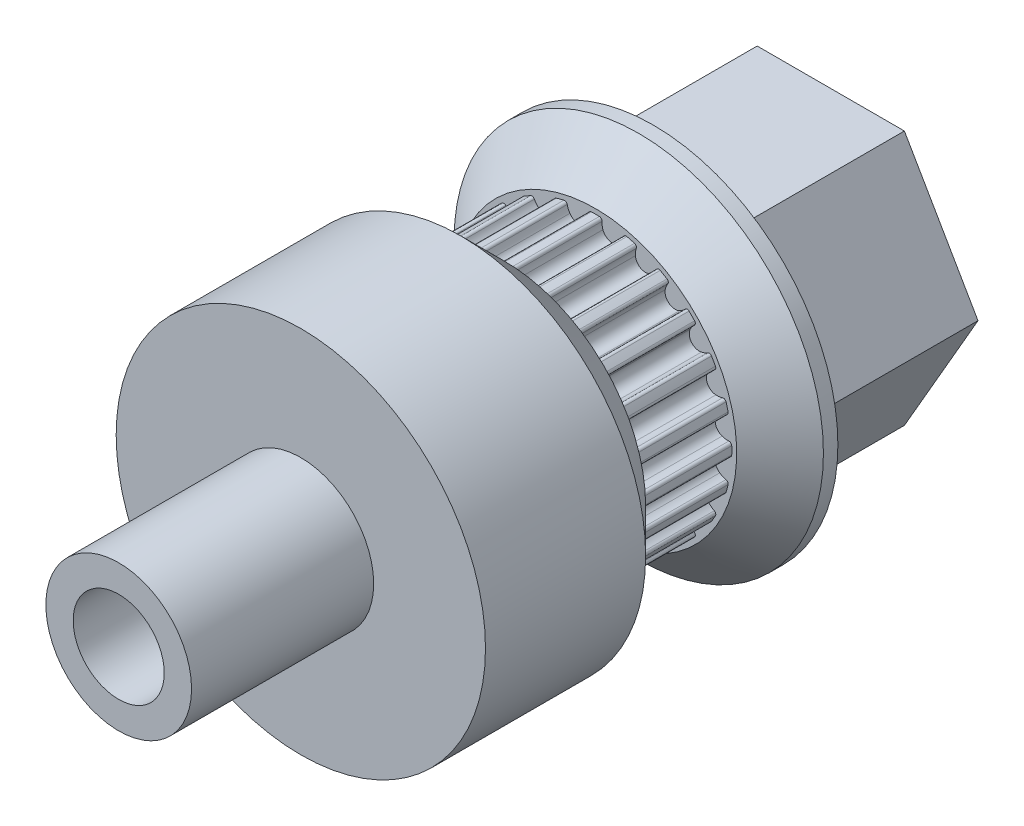
from build123d import *

# Parameters (mm, degrees)
SKETCH1_R           = 7.639437513
BASE_DEPTH          = 2.499999953
TOOTH_PROFILE_DEPTH = 12.904705376
TEETH_PATTERN_COUNT = 24
SKETCH3_R           = 10.139437466
FLANGE_DEPTH        = 3.175
FLANGE_CHAMFER_SIZE = 2.38125
ETCH_SIDE_1_DEPTH   = 1
ETCH_SIDE_2_DEPTH   = 1
EXTRUDE_THIN1_DEPTH = 9.74999997
SKETCH14_R          = 10.139437466
BOSS_EXTRUDE2_DEPTH = 8
SKETCH15_R          = 4
SKETCH15_R_2        = 2.5
BOSS_EXTRUDE3_DEPTH = 10
SKETCH16_R          = 1.7
CUT_EXTRUDE7_DEPTH  = 30.828


with BuildPart() as part:
    # Sketch1 → BASE (new, symmetric)
    with BuildSketch(Plane.XY):
        Circle(SKETCH1_R)
    extrude(amount=BASE_DEPTH, both=True)

    # Sketch2 → TOOTH PROFILE (cut, through all)
    with BuildSketch(Plane.XY.offset(2.499999953)):
        with BuildLine():
            Line((0, 7.489437513), (0, 7.639437513))
            ThreePointArc((0, 7.639437513), (0.997146689, 7.574081066), (1.977231922, 7.379129992))
            Line((1.977231922, 7.379129992), (1.938409065, 7.234241118))
            ThreePointArc((1.938409065, 7.234241118), (1.833403105, 7.261563696), (1.728012342, 7.287362184))
            ThreePointArc((1.728012342, 7.287362184), (1.613086529, 7.268094858), (1.546633428, 7.172370473))
            ThreePointArc((1.546633428, 7.172370473), (1.490520802, 6.99243079), (1.401639798, 6.826216821))
            ThreePointArc((1.401639798, 6.826216821), (0.866620497, 6.582636205), (0.412874839, 6.956390198))
            ThreePointArc((0.412874839, 6.956390198), (0.370041723, 7.139944659), (0.362412905, 7.328276062))
            ThreePointArc((0.362412905, 7.328276062), (0.322999432, 7.437938046), (0.216976372, 7.486293844))
            ThreePointArc((0.216976372, 7.486293844), (0.108499572, 7.488651554), (0, 7.489437513))
        make_face()
    tooth_profile = extrude(amount=-TOOTH_PROFILE_DEPTH, mode=Mode.SUBTRACT)

    # TEETH PATTERN: TOOTH PROFILE ×24 about axis
    teeth_pattern_axis = Axis((0, 0, 2.499999953), (0, 0, 1))
    for i in range(1, TEETH_PATTERN_COUNT):
        add(tooth_profile.rotate(teeth_pattern_axis, i * 360 / TEETH_PATTERN_COUNT), mode=Mode.SUBTRACT)

    # Sketch3 → FLANGE (add)
    with BuildSketch(Plane.XY.offset(2.499999953)):
        Circle(SKETCH3_R)
    flange = extrude(amount=FLANGE_DEPTH)

    # FLANGE MIRROR: FLANGE across plane
    add(flange.mirror(Plane.XY))

    # FLANGE CHAMFER
    flange_chamfer_edges = [part.edges().sort_by_distance(p)[0] for p in [
        (-10.139437466, 0, -2.499999953),
        (-10.139437466, 0, 2.499999953),
    ]]
    chamfer(flange_chamfer_edges, length=FLANGE_CHAMFER_SIZE)

    # Sketch5 → ETCH SIDE 1 (cut)
    # profile 1 of 6: a face of its own
    with BuildSketch(Plane.XY.offset(5.674999953)):
        with BuildLine():
            Line((7.298478857, 0.142073301), (7.304567713, 0.073742808))
            add(Edge.make_bspline(
                [(7.304567713, 0.073742808), (7.282933162, 0.070260249), (7.241743938, 0.063629932), (7.182595473, 0.055698868), (7.129424915, 0.048689949), (7.064518542, 0.042180075), (6.982596786, 0.037760982), (6.916465037, 0.036955959), (6.881730509, 0.036533134)],
                knots=[0, 0, 0, 0, 0.927990368, 1.766766639, 2.527291379, 3.199173674, 4.528915633, 6, 6, 6, 6], degree=3))
            add(Edge.make_bspline(
                [(6.881730509, 0.036533134), (6.856024037, 0.036133717), (6.806181008, 0.035359274), (6.733908845, 0.0370795), (6.666682583, 0.042808809), (6.602935425, 0.050271141), (6.540568812, 0.064592071), (6.476517727, 0.084012046), (6.410200765, 0.111923538), (6.342577693, 0.143985136), (6.279468598, 0.182036558), (6.225862563, 0.224290099), (6.184444081, 0.271174383), (6.156439253, 0.321707302), (6.137734913, 0.371324722), (6.123590492, 0.416867331), (6.112603689, 0.45759739), (6.109312376, 0.483676599), (6.10776929, 0.495903473)],
                knots=[0, 0, 0, 0, 1.235087634, 2.394747488, 3.470778428, 4.475920249, 5.474736677, 6.540465188, 7.687199385, 8.927597209, 10.133450132, 11.21968579, 12.195018352, 13.116837016, 13.977893521, 14.738569451, 15.40859588, 16, 16, 16, 16], degree=3))
            add(Edge.make_bspline(
                [(6.10776929, 0.495903473), (6.107616942, 0.511705522), (6.107313166, 0.543214215), (6.113597745, 0.590037812), (6.125413723, 0.635720778), (6.146831581, 0.695216762), (6.18583119, 0.764278543), (6.236183194, 0.826219761), (6.284473211, 0.869767327), (6.32596886, 0.900890212), (6.372274455, 0.930224528), (6.441210114, 0.965759835), (6.532622295, 1.005922559), (6.650082934, 1.039687935), (6.772602801, 1.065003372), (6.898889324, 1.083347794), (7.024001094, 1.096019337), (7.106539714, 1.095545504), (7.146257464, 1.095317494)],
                knots=[0, 0, 0, 0, 0.568209489, 1.132988467, 1.694022495, 2.264026182, 3.404755655, 4.529198959, 5.121032345, 5.741131268, 6.394139918, 7.091210227, 8.531028238, 9.979354147, 11.480458651, 13.031210498, 14.571412528, 16, 16, 16, 16], degree=3))
            add(Edge.make_bspline(
                [(7.146257464, 1.095317494), (7.187668008, 1.091784372), (7.27077648, 1.084693609), (7.371967624, 1.061200033), (7.449311364, 1.038364747), (7.501695524, 1.018561212), (7.54873833, 0.99740983), (7.604255036, 0.963643929), (7.669491402, 0.911866688), (7.714165978, 0.861758061), (7.73755301, 0.835526316)],
                knots=[0, 0, 0, 0, 1.49532033, 3.001017929, 3.730803778, 4.399146457, 5.016958745, 5.585321441, 6.735921635, 8, 8, 8, 8], degree=3))
            Line((7.73755301, 0.835526316), (7.897892878, 0.625122523))
            add(Edge.make_bspline(
                [(7.897892878, 0.625122523), (7.919542375, 0.598350427), (7.96065093, 0.547514965), (8.026662254, 0.480550108), (8.09572572, 0.426705985), (8.169047511, 0.386373808), (8.243610666, 0.357249898), (8.318322326, 0.33230058), (8.399489335, 0.315929873), (8.472015228, 0.304254374), (8.532652153, 0.298269202), (8.574839215, 0.295453956), (8.612110856, 0.294481105), (8.635323839, 0.295738243), (8.646145595, 0.296324313)],
                knots=[0, 0, 0, 0, 1.451825516, 2.756759206, 3.95735265, 5.132617887, 6.271994038, 7.330936624, 8.450443069, 9.759496282, 10.428703226, 11.019713953, 11.542996408, 12, 12, 12, 12], degree=3))
            Line((8.646145595, 0.296324313), (8.837606281, 0.303766248))
            Line((8.837606281, 0.303766248), (8.73950805, 1.11561368))
            add(Edge.make_bspline(
                [(8.73950805, 1.11561368), (8.738243992, 1.12604914), (8.735988918, 1.144665971), (8.714637711, 1.160077876), (8.690830947, 1.16268055), (8.661383022, 1.166624452), (8.619519914, 1.167742903), (8.587729692, 1.169015155), (8.569696628, 1.169736842)],
                knots=[0, 0, 0, 0, 0.918793301, 1.639124483, 2.184032478, 3.095419767, 4.352371459, 6, 6, 6, 6], degree=3))
            Line((8.569696628, 1.169736842), (8.172567926, 1.152823354))
            Line((8.172567926, 1.152823354), (8.16715561, 1.216418069))
            Line((8.16715561, 1.216418069), (8.765216552, 1.292190496))
            add(Edge.make_bspline(
                [(8.765216552, 1.292190496), (8.776715777, 1.293740337), (8.797219767, 1.296503819), (8.8237956, 1.300437538), (8.84253746, 1.301238063), (8.857360514, 1.303090612), (8.87113177, 1.299476409), (8.886622479, 1.29577443), (8.897252866, 1.27933357), (8.903176402, 1.254018625), (8.908926235, 1.215426465), (8.911756925, 1.185088634), (8.913378708, 1.167707224)],
                knots=[0, 0, 0, 0, 1.37378681, 2.449565873, 3.17208341, 3.599905265, 4.196640123, 4.855755316, 5.389491198, 6.394063803, 7.934056006, 10, 10, 10, 10], degree=3))
            Line((8.913378708, 1.167707224), (9.015536177, 0.264526955))
            add(Edge.make_bspline(
                [(9.015536177, 0.264526955), (9.016557753, 0.253355373), (9.018549136, 0.231578356), (8.998807563, 0.20779889), (8.973325804, 0.196264493), (8.942686911, 0.189201918), (8.901937261, 0.181414418), (8.831167826, 0.175051743), (8.7301402, 0.169144699), (8.646160085, 0.169138256), (8.602170526, 0.169134882)],
                knots=[0, 0, 0, 0, 0.564168291, 1.099745931, 1.467369891, 2.014285787, 2.730628101, 3.628051097, 5.709932818, 8, 8, 8, 8], degree=3))
            add(Edge.make_bspline(
                [(8.602170526, 0.169134882), (8.576676668, 0.170315651), (8.527215935, 0.172606467), (8.455466523, 0.178767418), (8.388847674, 0.186601678), (8.327261992, 0.196960239), (8.270897749, 0.208616685), (8.219818378, 0.223273211), (8.173312417, 0.238240003), (8.120185888, 0.262388505), (8.061920387, 0.294108252), (7.998588041, 0.32995729), (7.945004779, 0.365986126), (7.884371813, 0.412443123), (7.817669451, 0.477628282), (7.768332273, 0.53303842), (7.742965327, 0.561527807)],
                knots=[0, 0, 0, 0, 1.094235571, 2.122930727, 3.087255738, 3.969549398, 4.800258976, 5.553392952, 6.247539404, 6.892600786, 8.051857557, 9.09176301, 10.011672982, 10.818224363, 12.364074813, 14, 14, 14, 14], degree=3))
            Line((7.742965327, 0.561527807), (7.608333961, 0.736751545))
            add(Edge.make_bspline(
                [(7.608333961, 0.736751545), (7.597270916, 0.751130484), (7.576085194, 0.778666143), (7.542172116, 0.815639471), (7.507358244, 0.846292462), (7.471057793, 0.872699531), (7.428769248, 0.894308035), (7.378571202, 0.913904361), (7.318103971, 0.93015705), (7.225990119, 0.949674936), (7.104929754, 0.966187322), (6.957583664, 0.964889712), (6.80985614, 0.946026077), (6.713247542, 0.919908105), (6.663884781, 0.906562966)],
                knots=[0, 0, 0, 0, 0.640072608, 1.225738583, 1.76700799, 2.274895896, 2.805291533, 3.437799653, 4.173485007, 5.011660914, 6.760783288, 8.471798315, 10.197243523, 12, 12, 12, 12], degree=3))
            add(Edge.make_bspline(
                [(6.663884781, 0.906562966), (6.638448233, 0.897767609), (6.589059716, 0.880690227), (6.519447337, 0.848099074), (6.455106753, 0.81278142), (6.397132631, 0.772766092), (6.347548957, 0.725423079), (6.313564901, 0.665672981), (6.295315682, 0.59598294), (6.294332994, 0.546752492), (6.29381766, 0.520935436)],
                knots=[0, 0, 0, 0, 1.110370924, 2.155936176, 3.168698941, 4.137324436, 5.058950995, 5.972359123, 6.936679994, 8, 8, 8, 8], degree=3))
            add(Edge.make_bspline(
                [(6.29381766, 0.520935436), (6.294754085, 0.507343173), (6.296602009, 0.480520466), (6.306713149, 0.441216718), (6.3214247, 0.402985178), (6.350024945, 0.354113156), (6.397549199, 0.29814989), (6.468571964, 0.241627625), (6.552530006, 0.198231423), (6.647422155, 0.165816682), (6.754632298, 0.14645115), (6.874303162, 0.131684594), (7.007148635, 0.127581449), (7.099591009, 0.131330716), (7.147610543, 0.133278287)],
                knots=[0, 0, 0, 0, 0.471787123, 0.931015546, 1.401763489, 1.888935183, 2.888706429, 3.929781654, 5.0182593, 6.151484404, 7.395909201, 8.79048702, 10.332806586, 12, 12, 12, 12], degree=3))
            Line((7.147610543, 0.133278287), (7.298478857, 0.142073301))
        make_face()
    # profile 2 of 6: a face of its own
    with BuildSketch(Plane.XY.offset(5.674999953)):
        with BuildLine():
            Line((7.308056476, 3.620543329), (7.615205421, 3.053603205))
            Line((7.615205421, 3.053603205), (7.696390165, 3.041425494))
            add(Edge.make_bspline(
                [(7.696390165, 3.041425494), (7.704269246, 3.041773622), (7.715957132, 3.042290038), (7.732165329, 3.03164469), (7.723621017, 3.013933799), (7.716536378, 3.00433813), (7.711950574, 2.998126964)],
                knots=[0, 0, 0, 0, 1.305222549, 1.936176518, 2.664111062, 4, 4, 4, 4], degree=3))
            Line((7.711950574, 2.998126964), (7.591526538, 2.845905571))
            add(Edge.make_bspline(
                [(7.591526538, 2.845905571), (7.583841777, 2.838272344), (7.571105186, 2.825621165), (7.552811767, 2.811602944), (7.537655805, 2.806488887), (7.529077008, 2.805210552), (7.525225664, 2.804636659)],
                knots=[0, 0, 0, 0, 1.628174283, 2.698508017, 3.415711491, 4, 4, 4, 4], degree=3))
            Line((7.525225664, 2.804636659), (7.501546781, 2.833727859))
            Line((7.501546781, 2.833727859), (7.455542093, 2.867554835))
            Line((7.455542093, 2.867554835), (5.441483921, 2.772839302))
            Line((5.441483921, 2.772839302), (5.398861931, 2.863495598))
            Line((5.398861931, 2.863495598), (7.101035381, 3.664518398))
            add(Edge.make_bspline(
                [(7.101035381, 3.664518398), (7.097127849, 3.67288347), (7.090409234, 3.687266386), (7.078344974, 3.697462144), (7.07329726, 3.701728072)],
                knots=[0, 0, 0, 0, 1.163195476, 2, 2, 2, 2], degree=3))
            Line((7.07329726, 3.701728072), (7.019174098, 3.752468537))
            add(Edge.make_bspline(
                [(7.019174098, 3.752468537), (7.012101357, 3.758685513), (6.999516188, 3.769747944), (6.98405119, 3.785448247), (6.970931858, 3.794136483), (6.963709713, 3.798270492), (6.960991699, 3.799826304)],
                knots=[0, 0, 0, 0, 1.502025006, 2.67268932, 3.500473996, 4, 4, 4, 4], degree=3))
            Line((6.960991699, 3.799826304), (6.923105485, 3.817416331))
            Line((6.923105485, 3.817416331), (6.98805328, 3.989933911))
            add(Edge.make_bspline(
                [(6.98805328, 3.989933911), (6.992229013, 3.999030508), (6.999124664, 4.014052294), (7.016344483, 4.027895067), (7.031803045, 4.030257838), (7.044588213, 4.026246294), (7.055818404, 4.016022007), (7.06042676, 4.006001604), (7.063149167, 4.000082004)],
                knots=[0, 0, 0, 0, 1.657063283, 2.736413123, 3.536969343, 4.169583257, 4.918672724, 6, 6, 6, 6], degree=3))
            Line((7.063149167, 4.000082004), (7.232960589, 3.726083495))
            Line((7.232960589, 3.726083495), (7.973094831, 4.074501351))
            add(Edge.make_bspline(
                [(7.973094831, 4.074501351), (7.975354323, 4.07562033), (7.982856615, 4.079335726), (7.998370288, 4.087768009), (8.023531742, 4.099455183), (8.054472838, 4.11519628), (8.085358721, 4.130885776), (8.111431199, 4.141795979), (8.127844334, 4.147891923), (8.13995573, 4.149681441), (8.145593719, 4.142925316), (8.145606797, 4.13812631), (8.145612411, 4.136066448)],
                knots=[0, 0, 0, 0, 0.38348578, 1.273305016, 2.684616051, 4.602044951, 6.550213104, 7.964438783, 8.864773235, 9.276373366, 9.689400191, 10, 10, 10, 10], degree=3))
            add(Edge.make_bspline(
                [(8.145612411, 4.136066448), (8.145203257, 4.13168795), (8.143944068, 4.118212899), (8.128497661, 4.099357605), (8.112699091, 4.078728239), (8.100186941, 4.066739681), (8.094871946, 4.0616471)],
                knots=[0, 0, 0, 0, 0.566704114, 1.744060547, 3.041706953, 4, 4, 4, 4], degree=3))
            Line((8.094871946, 4.0616471), (8.038042626, 3.989257371))
            Line((8.038042626, 3.989257371), (7.990008319, 3.941223065))
            add(Edge.make_bspline(
                [(7.990008319, 3.941223065), (7.984325907, 3.934959444), (7.974142552, 3.923734516), (7.961101422, 3.908072727), (7.949166928, 3.898456696), (7.937015602, 3.886920796), (7.911011404, 3.880802578), (7.87500631, 3.872424731), (7.83471861, 3.864886236), (7.799979581, 3.855200053), (7.771295456, 3.842863616), (7.753199951, 3.834591464), (7.743747931, 3.830270582)],
                knots=[0, 0, 0, 0, 0.915624809, 1.64087556, 2.193899096, 2.574927163, 3.431459164, 4.981891214, 6.627638628, 7.847279751, 8.875546444, 10, 10, 10, 10], degree=3))
            Line((7.743747931, 3.830270582), (7.308056476, 3.620543329))
        make_face()
        Polygon((7.169365873, 3.560331311), (5.798020252, 2.914912602), (7.473132121, 2.991361569), align=None, mode=Mode.SUBTRACT)
    # profile 3 of 6: a face of its own
    with BuildSketch(Plane.XY.offset(5.674999953)):
        with BuildLine():
            Line((4.411661228, 4.548866596), (5.956877507, 6.115732141))
            Line((5.956877507, 6.115732141), (6.291088034, 6.422204546))
            add(Edge.make_bspline(
                [(6.291088034, 6.422204546), (6.30674588, 6.437562594), (6.334552445, 6.464836752), (6.370889417, 6.491417391), (6.395614224, 6.505559081), (6.406625499, 6.510399024), (6.416547555, 6.512428851), (6.41778189, 6.508392534), (6.418277465, 6.506771987)],
                knots=[0, 0, 0, 0, 2.455936303, 4.361465355, 5.087394218, 5.576696117, 5.830047036, 6, 6, 6, 6], degree=3))
            add(Edge.make_bspline(
                [(6.418277465, 6.506771987), (6.419520165, 6.50502446), (6.422648893, 6.500624735), (6.42458945, 6.489312418), (6.420223943, 6.4699682), (6.409276789, 6.444362456), (6.396187694, 6.415966532), (6.385698821, 6.398235685), (6.381067791, 6.390407188)],
                knots=[0, 0, 0, 0, 0.301821125, 0.75989082, 1.569888258, 3.078993884, 4.710321936, 6, 6, 6, 6], degree=3))
            Line((6.381067791, 6.390407188), (6.304618824, 6.234803097))
            add(Edge.make_bspline(
                [(6.304618824, 6.234803097), (6.298526583, 6.220707475), (6.287787927, 6.195861441), (6.271094919, 6.164864228), (6.259410821, 6.142981124), (6.244812338, 6.127907999), (6.223040566, 6.11852834), (6.195279631, 6.105867613), (6.163387345, 6.090602781), (6.131688472, 6.070280065), (6.099309345, 6.045557334), (6.062077847, 6.016294881), (6.017013813, 5.977576839), (5.96058391, 5.929703246), (5.894841627, 5.87023848), (5.850008316, 5.825480768), (5.826305379, 5.8018178)],
                knots=[0, 0, 0, 0, 0.981108778, 1.729378227, 2.253746267, 2.559679561, 3.05002191, 3.747060633, 4.52101745, 5.305252319, 6.150376702, 7.125638217, 8.333289201, 9.94917829, 11.858369822, 14, 14, 14, 14], degree=3))
            Line((5.826305379, 5.8018178), (4.505023682, 4.462269537))
            add(Edge.make_bspline(
                [(4.505023682, 4.462269537), (4.514207841, 4.453408875), (4.531209585, 4.437005988), (4.5541078, 4.416587371), (4.576681741, 4.397930857), (4.603246529, 4.376274655), (4.639474839, 4.345958247), (4.681972214, 4.310179798), (4.723696842, 4.275722472), (4.756527628, 4.247339362), (4.778625432, 4.230574579), (4.788296214, 4.221453842), (4.791199902, 4.218715307)],
                knots=[0, 0, 0, 0, 1.018473366, 1.885401316, 2.447695927, 3.355689774, 4.620852649, 6.217868175, 7.789529392, 8.93947027, 9.68157205, 10, 10, 10, 10], degree=3))
            Line((4.791199902, 4.218715307), (4.86629579, 4.165268684))
            Line((4.86629579, 4.165268684), (4.883885817, 3.960953747))
            add(Edge.make_bspline(
                [(4.883885817, 3.960953747), (4.883527037, 3.950650985), (4.882976345, 3.93483729), (4.877656721, 3.915069953), (4.86740248, 3.907680321), (4.856774992, 3.904939697), (4.843910519, 3.911037446), (4.83645107, 3.918026182), (4.831792274, 3.922390994)],
                knots=[0, 0, 0, 0, 1.901413427, 2.918476471, 3.536171655, 4.12577493, 4.829453592, 6, 6, 6, 6], degree=3))
            add(Edge.make_bspline(
                [(4.831792274, 3.922390994), (4.83025546, 3.924900965), (4.825036326, 3.933425014), (4.810921575, 3.949328709), (4.786784994, 3.972533092), (4.768149867, 3.991344039), (4.757372926, 4.002222658)],
                knots=[0, 0, 0, 0, 0.322614748, 1.095623952, 2.32036084, 4, 4, 4, 4], degree=3))
            Line((4.757372926, 4.002222658), (4.70866208, 4.05702236))
            add(Edge.make_bspline(
                [(4.70866208, 4.05702236), (4.707133547, 4.059318023), (4.702150601, 4.066801775), (4.688439495, 4.079705537), (4.667655519, 4.100361368), (4.650357004, 4.115754923), (4.640331588, 4.124676313)],
                knots=[0, 0, 0, 0, 0.342889521, 1.117803341, 2.329612596, 4, 4, 4, 4], degree=3))
            Line((4.640331588, 4.124676313), (4.572001096, 4.191653726))
            Line((4.572001096, 4.191653726), (4.396100819, 4.351993594))
            Line((4.396100819, 4.351993594), (4.256733676, 4.483242262))
            add(Edge.make_bspline(
                [(4.256733676, 4.483242262), (4.244737929, 4.494288189), (4.216504106, 4.520286463), (4.165283821, 4.556861748), (4.108910469, 4.599161449), (4.062133387, 4.635172771), (4.029084432, 4.66165963), (4.009722772, 4.675762165), (3.995497915, 4.684456799), (3.987057626, 4.686750317), (3.984088247, 4.687557199)],
                knots=[0, 0, 0, 0, 1.144674632, 2.694166473, 4.414756369, 6.097510271, 6.842315888, 7.387474225, 7.784507246, 8, 8, 8, 8], degree=3))
            Line((3.984088247, 4.687557199), (3.890725792, 4.72950265))
            Line((3.890725792, 4.72950265), (3.911021978, 4.939906443))
            add(Edge.make_bspline(
                [(3.911021978, 4.939906443), (3.912843647, 4.950232388), (3.915697975, 4.966411854), (3.920971697, 4.986288407), (3.92863683, 4.994875495), (3.935758954, 4.999206153), (3.943312494, 4.995244223), (3.951716652, 4.98823111), (3.96381586, 4.976406742), (3.973262063, 4.967396343), (3.97867593, 4.962232247)],
                knots=[0, 0, 0, 0, 2.070515672, 3.244239292, 3.900928124, 4.33598833, 4.713408341, 5.437910416, 6.531599131, 8, 8, 8, 8], degree=3))
            Line((3.97867593, 4.962232247), (4.047006423, 4.895254834))
            Line((4.047006423, 4.895254834), (4.29394335, 4.658465999))
            add(Edge.make_bspline(
                [(4.29394335, 4.658465999), (4.30555871, 4.645951279), (4.326506113, 4.623381948), (4.35573137, 4.594889046), (4.376789602, 4.573203814), (4.389713756, 4.562992152), (4.394747739, 4.559014689)],
                knots=[0, 0, 0, 0, 1.445295979, 2.606479427, 3.457220966, 4, 4, 4, 4], degree=3))
            Line((4.394747739, 4.559014689), (4.411661228, 4.548866596))
        make_face()
    # profile 4 of 6: a face of its own
    with BuildSketch(Plane.XY.offset(5.674999953)):
        with BuildLine():
            add(Edge.make_bspline(
                [(0.163199914, 7.817812306), (0.175206441, 7.821487688), (0.19683339, 7.828108029), (0.224586173, 7.838843901), (0.245737677, 7.845159106), (0.25681134, 7.849770746), (0.261298146, 7.851639282)],
                knots=[0, 0, 0, 0, 1.451158923, 2.613923149, 3.438392033, 4, 4, 4, 4], degree=3))
            Line((0.261298146, 7.851639282), (0.318127466, 7.874641626))
            Line((0.318127466, 7.874641626), (0.436521883, 7.746775656))
            add(Edge.make_bspline(
                [(0.436521883, 7.746775656), (0.444756141, 7.740503374), (0.457125996, 7.731080883), (0.465639856, 7.711861807), (0.460229161, 7.700960767), (0.456211957, 7.69213634), (0.447159471, 7.686348467), (0.440404466, 7.683907436), (0.436521883, 7.682504401)],
                knots=[0, 0, 0, 0, 2.12485784, 3.192052727, 3.879241836, 4.521424808, 5.150157431, 6, 6, 6, 6], degree=3))
            Line((0.436521883, 7.682504401), (0.327599019, 7.690622875))
            Line((0.327599019, 7.690622875), (0.229500788, 7.675062466))
            Line((0.229500788, 7.675062466), (0.109753292, 7.661531675))
            add(Edge.make_bspline(
                [(0.109753292, 7.661531675), (0.101353597, 7.660880873), (0.079156408, 7.659161051), (0.045180807, 7.647878569), (0.009680218, 7.637375772), (-0.006450792, 7.621628059), (-0.012700363, 7.615526987)],
                knots=[0, 0, 0, 0, 0.75497879, 1.995120783, 3.223257892, 4, 4, 4, 4], degree=3))
            Line((-0.012700363, 7.615526987), (-0.043144641, 7.572228458))
            Line((-0.043144641, 7.572228458), (-0.171010612, 7.705506744))
            add(Edge.make_bspline(
                [(-0.171010612, 7.705506744), (-0.175813075, 7.712022049), (-0.18517858, 7.724727846), (-0.186423592, 7.746594491), (-0.184881321, 7.765130383), (-0.177169411, 7.771532595), (-0.17439331, 7.773837237)],
                knots=[0, 0, 0, 0, 1.255743359, 2.448883123, 3.441635416, 4, 4, 4, 4], degree=3))
            Line((-0.17439331, 7.773837237), (-0.142595952, 7.776543395))
            Line((-0.142595952, 7.776543395), (0.032627786, 7.791427264))
            Line((0.032627786, 7.791427264), (0.117195226, 8.924630972))
            add(Edge.make_bspline(
                [(0.117195226, 8.924630972), (0.118338422, 8.937712188), (0.120466626, 8.962064539), (0.123197574, 8.995876225), (0.125225961, 9.024477712), (0.129693756, 9.047082254), (0.130378663, 9.065162303), (0.134140096, 9.076121714), (0.134874435, 9.084583377), (0.144355992, 9.087397476), (0.151514363, 9.063054883), (0.165644141, 9.043510688), (0.178768294, 9.016056124), (0.185157811, 8.999262794), (0.187555337, 8.992961464)],
                knots=[0, 0, 0, 0, 1.755941838, 3.268909553, 4.541487355, 5.57805892, 6.367499829, 6.894273745, 7.219139053, 7.314522792, 8.110848491, 9.581738735, 11.092600299, 12, 12, 12, 12], degree=3))
            Line((0.187555337, 8.992961464), (0.205145365, 8.931396367))
            Line((0.205145365, 8.931396367), (0.24032542, 8.851564703))
            add(Edge.make_bspline(
                [(0.24032542, 8.851564703), (0.245984733, 8.838699064), (0.255889211, 8.816182646), (0.257307538, 8.791698682), (0.257915448, 8.781204592)],
                knots=[0, 0, 0, 0, 1.14277849, 2, 2, 2, 2], degree=3))
            Line((0.257915448, 8.781204592), (0.24100196, 8.736552984))
            Line((0.24100196, 8.736552984), (0.201762667, 8.574860037))
            add(Edge.make_bspline(
                [(0.201762667, 8.574860037), (0.20824209, 8.587865381), (0.224008231, 8.619510805), (0.246183897, 8.676472693), (0.279048591, 8.744755312), (0.313527681, 8.806296306), (0.34907413, 8.854965497), (0.382044452, 8.888800451), (0.420935672, 8.917619252), (0.464263841, 8.942617432), (0.510714977, 8.962835011), (0.559311299, 8.975992675), (0.608472848, 8.985054428), (0.641697634, 8.984913799), (0.658426848, 8.98484299)],
                knots=[0, 0, 0, 0, 0.788848767, 1.919476567, 3.316530028, 4.902620512, 5.742854681, 6.582999573, 7.457528729, 8.362989126, 9.295788775, 10.199258784, 11.093297827, 12, 12, 12, 12], degree=3))
            add(Edge.make_bspline(
                [(0.658426848, 8.98484299), (0.688606008, 8.983877041), (0.748593053, 8.981957027), (0.834661099, 8.95633707), (0.914196898, 8.920832932), (0.973530656, 8.880098692), (1.016464783, 8.841286818), (1.04664203, 8.80573997), (1.075797196, 8.764987209), (1.103505176, 8.71844198), (1.130774973, 8.666210713), (1.156181541, 8.607306539), (1.180450397, 8.541945589), (1.204031081, 8.470735459), (1.225803728, 8.393883227), (1.24374674, 8.311796768), (1.25934625, 8.225138241), (1.275781456, 8.106153744), (1.290120455, 7.960696495), (1.294297192, 7.790302239), (1.290602117, 7.62056721), (1.279647566, 7.443620444), (1.261235384, 7.256348178), (1.238850144, 7.12964984), (1.22739659, 7.064823812)],
                knots=[0, 0, 0, 0, 0.889696848, 1.768448351, 2.634088374, 3.459306508, 3.884241314, 4.342964764, 4.835372297, 5.365046509, 5.943855053, 6.577142631, 7.261068389, 8.005702167, 8.795544289, 9.622539926, 10.490054159, 11.399463164, 13.175026676, 14.809995815, 16.437969103, 18.195586038, 20.053446875, 22, 22, 22, 22], degree=3))
            add(Edge.make_bspline(
                [(1.22739659, 7.064823812), (1.21606075, 7.011004173), (1.192642582, 6.89982077), (1.153116546, 6.761843855), (1.115527454, 6.649992419), (1.081170522, 6.568060505), (1.043659218, 6.488013169), (1.001469385, 6.412328842), (0.958073076, 6.342386173), (0.911809312, 6.282355919), (0.864779585, 6.232435101), (0.816380435, 6.193673216), (0.769687571, 6.164656689), (0.727588878, 6.140786948), (0.688934613, 6.124397146), (0.642344069, 6.110616615), (0.584245869, 6.103410648), (0.538011429, 6.10299669), (0.514323929, 6.102784605)],
                knots=[0, 0, 0, 0, 2.024694551, 4.182719048, 5.280381461, 6.367534551, 7.452115921, 8.533673286, 9.556481116, 10.479950211, 11.319776018, 12.07582493, 12.75536141, 13.342522989, 13.856079626, 14.297506436, 15.127753738, 16, 16, 16, 16], degree=3))
            add(Edge.make_bspline(
                [(0.514323929, 6.102784605), (0.485389631, 6.106439153), (0.429274931, 6.113526723), (0.35074789, 6.14599951), (0.28236067, 6.196419993), (0.232584906, 6.248469644), (0.199124705, 6.294068302), (0.17622848, 6.323333204), (0.1592424, 6.349368459), (0.149840647, 6.365475676), (0.145609887, 6.372723876)],
                knots=[0, 0, 0, 0, 1.46206978, 2.835514087, 4.217457569, 5.709710422, 6.437989883, 7.061878063, 7.577847899, 8, 8, 8, 8], degree=3))
            Line((0.145609887, 6.372723876), (0.115165608, 6.447819764))
            Line((0.115165608, 6.447819764), (0.036010483, 6.129169647))
            Line((0.036010483, 6.129169647), (-0.018789218, 6.133228884))
            Line((-0.018789218, 6.133228884), (0.073896697, 7.366560441))
            Line((0.073896697, 7.366560441), (0.16928877, 7.363854283))
            add(Edge.make_bspline(
                [(0.16928877, 7.363854283), (0.167717297, 7.342430093), (0.164326349, 7.296200673), (0.158845647, 7.223619582), (0.154152393, 7.146282866), (0.151462969, 7.079727829), (0.151591878, 7.023550973), (0.152524129, 6.975523134), (0.152787716, 6.921382145), (0.155650178, 6.843981955), (0.161052137, 6.750868469), (0.172857855, 6.646557889), (0.196583164, 6.551102615), (0.226423946, 6.476391565), (0.256780742, 6.420420707), (0.282161015, 6.383232075), (0.310423534, 6.351459822), (0.350964733, 6.316110647), (0.410874827, 6.282774549), (0.463618128, 6.270229429), (0.490645045, 6.263801012)],
                knots=[0, 0, 0, 0, 0.927593782, 2.001574902, 3.142928461, 4.273178364, 4.876918615, 5.568367151, 6.347447688, 7.214599298, 8.912349548, 10.375022528, 11.740114206, 13.146940491, 13.835503113, 14.486477076, 15.086515055, 15.666381272, 16.80419845, 18, 18, 18, 18], degree=3))
            add(Edge.make_bspline(
                [(0.490645045, 6.263801012), (0.512070321, 6.262180036), (0.553676121, 6.259032257), (0.615098258, 6.26639516), (0.673050452, 6.281929456), (0.728589033, 6.306549924), (0.780495082, 6.342873772), (0.830336398, 6.389385954), (0.876922448, 6.447908414), (0.920537995, 6.515975604), (0.960144934, 6.590819593), (0.99609034, 6.668724938), (1.027543308, 6.748552654), (1.0605015, 6.85641779), (1.094085892, 6.988484516), (1.120878456, 7.144078537), (1.138972082, 7.295497831), (1.147405189, 7.395623821), (1.151624163, 7.445715566)],
                knots=[0, 0, 0, 0, 0.687500329, 1.335058718, 1.971748052, 2.606051694, 3.271880533, 3.993223294, 4.784816052, 5.663247459, 6.581940126, 7.497497607, 8.413226375, 9.330238775, 11.111936943, 12.778533562, 14.388341762, 16, 16, 16, 16], degree=3))
            add(Edge.make_bspline(
                [(1.151624163, 7.445715566), (1.155260923, 7.511996172), (1.162778129, 7.648998599), (1.160862553, 7.821948683), (1.155120662, 7.962029458), (1.147075133, 8.062693734), (1.13571614, 8.157067595), (1.120827652, 8.244579141), (1.103822276, 8.324796885), (1.086489606, 8.397067232), (1.068433707, 8.460803215), (1.049272903, 8.51629492), (1.029404051, 8.565417023), (1.008108751, 8.609290395), (0.984342169, 8.648303902), (0.950694141, 8.691981603), (0.907529142, 8.738296895), (0.85034301, 8.781444285), (0.787324394, 8.811515594), (0.741939323, 8.820097313), (0.718638866, 8.824503122)],
                knots=[0, 0, 0, 0, 2.300363536, 4.754865868, 5.991120362, 7.159583917, 8.25420495, 9.284827993, 10.2353241, 11.09605197, 11.860534348, 12.530451183, 13.129948856, 13.696270654, 14.219115681, 14.710016147, 15.605705383, 16.404581088, 17.180920301, 18, 18, 18, 18], degree=3))
            add(Edge.make_bspline(
                [(0.718638866, 8.824503122), (0.697441787, 8.826715809), (0.654695751, 8.831177913), (0.589937335, 8.822053114), (0.52564021, 8.802186846), (0.465158066, 8.765707879), (0.40780085, 8.716098856), (0.357474448, 8.651572229), (0.313409527, 8.575905141), (0.2799234, 8.490851649), (0.254512579, 8.400910555), (0.232904437, 8.310122993), (0.216962792, 8.221132377), (0.201832297, 8.134634211), (0.189679687, 8.046106367), (0.182079082, 7.985601468), (0.178083784, 7.953796751)],
                knots=[0, 0, 0, 0, 0.776822952, 1.566541373, 2.37245821, 3.222569437, 4.128758638, 5.132118703, 6.200102994, 7.321158231, 8.464233858, 9.616495723, 10.732595156, 11.769821024, 12.827694751, 14, 14, 14, 14], degree=3))
            Line((0.178083784, 7.953796751), (0.163199914, 7.817812306))
        make_face()
    # profile 5 of 6: a face of its own
    with BuildSketch(Plane.XY.offset(5.674999953)):
        with BuildLine():
            Line((-1.800073689, 6.077363823), (-2.402870408, 8.193579463))
            Line((-2.402870408, 8.193579463), (-2.504351337, 8.635359774))
            add(Edge.make_bspline(
                [(-2.504351337, 8.635359774), (-2.50962573, 8.656717584), (-2.518985865, 8.694619953), (-2.526424296, 8.739382756), (-2.524599318, 8.767601811), (-2.524368254, 8.779647433), (-2.521177245, 8.789258052), (-2.516905043, 8.788545924), (-2.515175969, 8.788257707)],
                knots=[0, 0, 0, 0, 2.463818867, 4.372385104, 5.080292062, 5.563003717, 5.82313602, 6, 6, 6, 6], degree=3))
            add(Edge.make_bspline(
                [(-2.515175969, 8.788257707), (-2.513140978, 8.788347533), (-2.507813774, 8.788582678), (-2.49675131, 8.785165288), (-2.481530839, 8.772064787), (-2.465230344, 8.749293357), (-2.446165928, 8.724547542), (-2.436291685, 8.706286033), (-2.431961608, 8.69827795)],
                knots=[0, 0, 0, 0, 0.287060104, 0.751466571, 1.593533706, 3.067992328, 4.714248585, 6, 6, 6, 6], degree=3))
            Line((-2.431961608, 8.69827795), (-2.334539916, 8.554851571))
            add(Edge.make_bspline(
                [(-2.334539916, 8.554851571), (-2.325436294, 8.542507492), (-2.309389874, 8.520749311), (-2.289613646, 8.491859866), (-2.277062663, 8.470912157), (-2.270544692, 8.451274436), (-2.273547733, 8.427744709), (-2.275963406, 8.397314666), (-2.277516666, 8.361806313), (-2.276205781, 8.323794668), (-2.270965041, 8.28319316), (-2.263124483, 8.236515975), (-2.251179089, 8.178540456), (-2.238104988, 8.105566299), (-2.218801148, 8.018989445), (-2.201990145, 7.957846835), (-2.193143155, 7.925669811)],
                knots=[0, 0, 0, 0, 0.981166721, 1.729444901, 2.23952919, 2.540781361, 3.031523804, 3.7264376, 4.506049333, 5.300078723, 6.157263192, 7.122603606, 8.327957714, 9.943629068, 11.865286584, 14, 14, 14, 14], degree=3))
            Line((-2.193143155, 7.925669811), (-1.677620035, 6.116603115))
            add(Edge.make_bspline(
                [(-1.677620035, 6.116603115), (-1.665208267, 6.120404857), (-1.642569489, 6.127339145), (-1.61335396, 6.136735232), (-1.586119139, 6.147428048), (-1.554108022, 6.15904007), (-1.510516235, 6.176733857), (-1.458704163, 6.195314132), (-1.408522354, 6.215140647), (-1.367797147, 6.229900174), (-1.34162679, 6.23934231), (-1.328977737, 6.243795545), (-1.325142942, 6.245145626)],
                knots=[0, 0, 0, 0, 1.03782642, 1.892971358, 2.452131242, 3.376320999, 4.615019096, 6.212307352, 7.775869452, 8.927972531, 9.674994919, 10, 10, 10, 10], degree=3))
            Line((-1.325142942, 6.245145626), (-1.24125204, 6.284384918))
            Line((-1.24125204, 6.284384918), (-1.05588021, 6.199140938))
            add(Edge.make_bspline(
                [(-1.05588021, 6.199140938), (-1.046743573, 6.194390608), (-1.032496722, 6.18698337), (-1.018250601, 6.172154242), (-1.016505275, 6.159221599), (-1.020084458, 6.148688662), (-1.031361404, 6.140310825), (-1.041063798, 6.137370818), (-1.047085196, 6.135546222)],
                knots=[0, 0, 0, 0, 1.878167752, 2.928646049, 3.549304832, 4.159026039, 4.857474176, 6, 6, 6, 6], degree=3))
            add(Edge.make_bspline(
                [(-1.047085196, 6.135546222), (-1.050027632, 6.135390843), (-1.059922163, 6.134868349), (-1.080205175, 6.128692225), (-1.112951853, 6.121429464), (-1.138469498, 6.113670918), (-1.153301902, 6.109161181)],
                knots=[0, 0, 0, 0, 0.321932075, 1.082561103, 2.304207435, 4, 4, 4, 4], degree=3))
            Line((-1.153301902, 6.109161181), (-1.225015092, 6.094277311))
            add(Edge.make_bspline(
                [(-1.225015092, 6.094277311), (-1.227505916, 6.094111282), (-1.236286776, 6.093525984), (-1.253905438, 6.087647642), (-1.282310177, 6.080018177), (-1.304219555, 6.072365101), (-1.317024467, 6.06789227)],
                knots=[0, 0, 0, 0, 0.311704789, 1.098847282, 2.304424392, 4, 4, 4, 4], degree=3))
            Line((-1.317024467, 6.06789227), (-1.409033843, 6.041507228))
            Line((-1.409033843, 6.041507228), (-1.635674584, 5.96776442))
            Line((-1.635674584, 5.96776442), (-1.818340257, 5.91025856))
            add(Edge.make_bspline(
                [(-1.818340257, 5.91025856), (-1.83401267, 5.905365918), (-1.870820856, 5.893875072), (-1.927944762, 5.867141562), (-1.992345372, 5.838473823), (-2.046660459, 5.815789435), (-2.086127813, 5.79994335), (-2.10753684, 5.789546567), (-2.122895024, 5.782426962), (-2.128743586, 5.775977295), (-2.130901518, 5.773597575)],
                knots=[0, 0, 0, 0, 1.150662873, 2.702443665, 4.416396303, 6.097022179, 6.834501977, 7.393617414, 7.776264313, 8, 8, 8, 8], degree=3))
            Line((-2.130901518, 5.773597575), (-2.212762801, 5.712709018))
            Line((-2.212762801, 5.712709018), (-2.38528038, 5.834486133))
            add(Edge.make_bspline(
                [(-2.38528038, 5.834486133), (-2.393298892, 5.841363226), (-2.405858882, 5.852135327), (-2.421756135, 5.866016784), (-2.424620719, 5.877142271), (-2.42511096, 5.885644428), (-2.4172489, 5.889530949), (-2.407588336, 5.894256944), (-2.391659105, 5.899414292), (-2.379408802, 5.902874134), (-2.372426129, 5.904846244)],
                knots=[0, 0, 0, 0, 2.10197825, 3.292484615, 3.936698926, 4.38135387, 4.761962208, 5.494344306, 6.571776095, 8, 8, 8, 8], degree=3))
            Line((-2.372426129, 5.904846244), (-2.280416754, 5.931231285))
            Line((-2.280416754, 5.931231285), (-1.952295083, 6.028652977))
            add(Edge.make_bspline(
                [(-1.952295083, 6.028652977), (-1.935582458, 6.032851775), (-1.905708372, 6.040357195), (-1.866321535, 6.051426362), (-1.837387259, 6.059441174), (-1.822144817, 6.065552938), (-1.816310638, 6.06789227)],
                knots=[0, 0, 0, 0, 1.459791869, 2.609401462, 3.46773617, 4, 4, 4, 4], degree=3))
            Line((-1.816310638, 6.06789227), (-1.800073689, 6.077363823))
        make_face()
    # profile 6 of 6: a face of its own
    with BuildSketch(Plane.XY.offset(5.674999953)):
        with BuildLine():
            Line((-3.885504604, 6.179484815), (-3.830028363, 6.220077187))
            add(Edge.make_bspline(
                [(-3.830028363, 6.220077187), (-3.816087665, 6.20313134), (-3.789526851, 6.170844902), (-3.750980239, 6.125268711), (-3.719027698, 6.082321049), (-3.679732461, 6.030484597), (-3.632347214, 5.96343041), (-3.597852789, 5.906838803), (-3.579708738, 5.877071646)],
                knots=[0, 0, 0, 0, 0.92908165, 1.770152701, 2.526357568, 3.194701276, 4.524414268, 6, 6, 6, 6], degree=3))
            add(Edge.make_bspline(
                [(-3.579708738, 5.877071646), (-3.566044393, 5.85528083), (-3.539556113, 5.813039417), (-3.503355205, 5.750458353), (-3.473774328, 5.689821695), (-3.447717126, 5.631286153), (-3.426616683, 5.570823458), (-3.411520146, 5.505451343), (-3.399955625, 5.434273285), (-3.393460896, 5.359465763), (-3.392306985, 5.285890902), (-3.401794147, 5.218132288), (-3.419883957, 5.158411437), (-3.449408369, 5.108823401), (-3.482245028, 5.067826981), (-3.51317252, 5.03172133), (-3.542738362, 5.001499059), (-3.563318293, 4.984993553), (-3.572943343, 4.977274076)],
                knots=[0, 0, 0, 0, 1.235780254, 2.39555515, 3.471256399, 4.475680141, 5.472772438, 6.542344909, 7.694808947, 8.934714565, 10.148207683, 11.220794198, 12.211034358, 13.123537303, 13.973081982, 14.733447498, 15.407644736, 16, 16, 16, 16], degree=3))
            add(Edge.make_bspline(
                [(-3.572943343, 4.977274076), (-3.586525783, 4.969050862), (-3.613599735, 4.952659486), (-3.657146312, 4.934051151), (-3.702103977, 4.919355357), (-3.764062516, 4.908080378), (-3.843344127, 4.905529785), (-3.922195354, 4.916813792), (-3.984970097, 4.934744535), (-4.032663441, 4.954791843), (-4.081802681, 4.979268717), (-4.148298671, 5.019097208), (-4.228890695, 5.078151602), (-4.319381144, 5.160155942), (-4.404053805, 5.252595189), (-4.486578043, 5.350064294), (-4.560593974, 5.45193964), (-4.602685037, 5.52292255), (-4.622932689, 5.55706845)],
                knots=[0, 0, 0, 0, 0.570496545, 1.137173921, 1.699011549, 2.268584586, 3.396876705, 4.536051663, 5.1188159, 5.740956398, 6.393956826, 7.09233984, 8.526689978, 9.979818591, 11.477810681, 13.032643567, 14.572571077, 16, 16, 16, 16], degree=3))
            add(Edge.make_bspline(
                [(-4.622932689, 5.55706845), (-4.641026427, 5.59440777), (-4.677354606, 5.669376771), (-4.711549963, 5.767397971), (-4.731432447, 5.84576191), (-4.741970494, 5.900864077), (-4.746531556, 5.952289132), (-4.74802837, 6.016999335), (-4.73544777, 6.099357111), (-4.716221009, 6.163478251), (-4.706147051, 6.197074843)],
                knots=[0, 0, 0, 0, 1.494424634, 3.0004703, 3.729724447, 4.407149437, 5.01928093, 5.588189413, 6.736319784, 8, 8, 8, 8], degree=3))
            Line((-4.706147051, 6.197074843), (-4.608048819, 6.44333523))
            add(Edge.make_bspline(
                [(-4.608048819, 6.44333523), (-4.596396578, 6.475845894), (-4.57440399, 6.53720693), (-4.552065634, 6.628206033), (-4.540691939, 6.714775639), (-4.544158919, 6.798558995), (-4.556595952, 6.877842238), (-4.574779462, 6.954682628), (-4.601834364, 7.0330355), (-4.631101623, 7.100504918), (-4.655319158, 7.156443818), (-4.675732925, 7.193484693), (-4.693026782, 7.226428195), (-4.706621573, 7.245161095), (-4.712912446, 7.253829584)],
                knots=[0, 0, 0, 0, 1.456384786, 2.748798949, 3.946757239, 5.127280615, 6.272493732, 7.329517234, 8.45491196, 9.764377639, 10.432965716, 11.024606343, 11.548644932, 12, 12, 12, 12], degree=3))
            Line((-4.712912446, 7.253829584), (-4.818452612, 7.414169452))
            Line((-4.818452612, 7.414169452), (-5.463871321, 6.910824044))
            add(Edge.make_bspline(
                [(-5.463871321, 6.910824044), (-5.471934024, 6.904182721), (-5.486365403, 6.892295461), (-5.488981471, 6.866195366), (-5.479371972, 6.84421666), (-5.465231717, 6.817927283), (-5.446140149, 6.780732389), (-5.430188456, 6.753109462), (-5.421249331, 6.737629925)],
                knots=[0, 0, 0, 0, 0.917463035, 1.642161055, 2.188765972, 3.090409493, 4.369502453, 6, 6, 6, 6], degree=3))
            Line((-5.421249331, 6.737629925), (-5.202050524, 6.406125556))
            Line((-5.202050524, 6.406125556), (-5.254144068, 6.367562803))
            Line((-5.254144068, 6.367562803), (-5.628270426, 6.841817012))
            add(Edge.make_bspline(
                [(-5.628270426, 6.841817012), (-5.635523747, 6.850801767), (-5.648328333, 6.866662924), (-5.66461868, 6.887837913), (-5.675910524, 6.902567199), (-5.685291848, 6.914391825), (-5.688153946, 6.928457289), (-5.694333123, 6.943547871), (-5.684590929, 6.961103245), (-5.665936176, 6.978884769), (-5.635727792, 7.004002326), (-5.611234763, 7.022159532), (-5.597149608, 7.032601158)],
                knots=[0, 0, 0, 0, 1.366463662, 2.412274421, 3.153936235, 3.575716423, 4.166208686, 4.846308804, 5.371759576, 6.391037456, 7.924601451, 10, 10, 10, 10], degree=3))
            Line((-5.597149608, 7.032601158), (-4.877311551, 7.586687031))
            add(Edge.make_bspline(
                [(-4.877311551, 7.586687031), (-4.868097127, 7.593679484), (-4.850387939, 7.607118268), (-4.819557388, 7.601675061), (-4.796487165, 7.586062026), (-4.774654959, 7.563386896), (-4.747414246, 7.532320916), (-4.705436754, 7.474955968), (-4.64723393, 7.392133918), (-4.604187259, 7.319991572), (-4.581663778, 7.282244244)],
                knots=[0, 0, 0, 0, 0.577443408, 1.10978764, 1.483921871, 2.022939917, 2.737751217, 3.633628251, 5.71536588, 8, 8, 8, 8], degree=3))
            add(Edge.make_bspline(
                [(-4.581663778, 7.282244244), (-4.569561951, 7.259770851), (-4.546030777, 7.216072876), (-4.514425074, 7.151538725), (-4.487196898, 7.09034723), (-4.464006437, 7.032641574), (-4.444802378, 6.978123775), (-4.430874609, 6.926711442), (-4.419912275, 6.878960472), (-4.413768902, 6.820958461), (-4.409106354, 6.754857848), (-4.408684592, 6.682136822), (-4.410717012, 6.617686822), (-4.420163923, 6.541940666), (-4.439884869, 6.450951801), (-4.462026222, 6.380255559), (-4.473417453, 6.34388392)],
                knots=[0, 0, 0, 0, 1.094936946, 2.129029955, 3.081864216, 3.967549478, 4.796688581, 5.559508335, 6.252101869, 6.895296828, 8.058821788, 9.094045571, 10.013943693, 10.822739736, 12.365370465, 14, 14, 14, 14], degree=3))
            Line((-4.473417453, 6.34388392), (-4.555278736, 6.137539364))
            add(Edge.make_bspline(
                [(-4.555278736, 6.137539364), (-4.561620796, 6.120712193), (-4.573831613, 6.088313649), (-4.587464471, 6.039907397), (-4.596478625, 5.994235225), (-4.600398533, 5.949268806), (-4.5972295, 5.902168724), (-4.587094889, 5.849480998), (-4.570612437, 5.78939602), (-4.540079307, 5.700273579), (-4.491275142, 5.588278541), (-4.41380952, 5.463005899), (-4.32154794, 5.34603176), (-4.249235459, 5.276609452), (-4.212273196, 5.241124491)],
                knots=[0, 0, 0, 0, 0.634511232, 1.221669352, 1.772755409, 2.275815354, 2.810088206, 3.433060533, 4.166811215, 5.007567188, 6.757366169, 8.465218624, 10.193209282, 12, 12, 12, 12], degree=3))
            add(Edge.make_bspline(
                [(-4.212273196, 5.241124491), (-4.191798493, 5.224082934), (-4.151603239, 5.190627516), (-4.088076776, 5.147587839), (-4.024114994, 5.111423071), (-3.960349649, 5.082162501), (-3.894258915, 5.063963527), (-3.825567646, 5.066018537), (-3.756243168, 5.085621816), (-3.713638653, 5.110424109), (-3.69133776, 5.123406613)],
                knots=[0, 0, 0, 0, 1.100286431, 2.160045686, 3.165689339, 4.13366618, 5.055834233, 5.969297036, 6.937049554, 8, 8, 8, 8], degree=3))
            add(Edge.make_bspline(
                [(-3.69133776, 5.123406613), (-3.680294825, 5.131249623), (-3.658189033, 5.146949791), (-3.628975671, 5.175458786), (-3.60439966, 5.208485711), (-3.577213565, 5.257971329), (-3.553287329, 5.327238878), (-3.543413948, 5.417239571), (-3.547960019, 5.511493941), (-3.570605317, 5.609568535), (-3.607276856, 5.71219947), (-3.658194776, 5.821400127), (-3.722404382, 5.937592146), (-3.773119026, 6.015186202), (-3.799584085, 6.055678081)],
                knots=[0, 0, 0, 0, 0.469172592, 0.939191537, 1.408364129, 1.891406877, 2.892949647, 3.924921992, 5.013215888, 6.149742847, 7.401114095, 8.786674486, 10.323150057, 12, 12, 12, 12], degree=3))
            Line((-3.799584085, 6.055678081), (-3.885504604, 6.179484815))
        make_face()
    extrude(amount=-ETCH_SIDE_1_DEPTH, mode=Mode.SUBTRACT)

    # Sketch6 → ETCH SIDE 2 (cut)
    # profile 1 of 6: a face of its own
    with BuildSketch(Plane(origin=(0, 0, -5.674999953), x_dir=(-1, 0, 0), z_dir=(0, 0, -1))):
        with BuildLine():
            Line((7.298478857, 0.142073301), (7.304567713, 0.073742808))
            add(Edge.make_bspline(
                [(7.304567713, 0.073742808), (7.282933162, 0.070260249), (7.241743938, 0.063629932), (7.182595473, 0.055698868), (7.129424915, 0.048689949), (7.064518542, 0.042180075), (6.982596786, 0.037760982), (6.916465037, 0.036955959), (6.881730509, 0.036533134)],
                knots=[0, 0, 0, 0, 0.927990368, 1.766766639, 2.527291379, 3.199173674, 4.528915633, 6, 6, 6, 6], degree=3))
            add(Edge.make_bspline(
                [(6.881730509, 0.036533134), (6.856024037, 0.036133717), (6.806181008, 0.035359274), (6.733908845, 0.0370795), (6.666682583, 0.042808809), (6.602935425, 0.050271141), (6.540568812, 0.064592071), (6.476517727, 0.084012046), (6.410200765, 0.111923538), (6.342577693, 0.143985136), (6.279468598, 0.182036558), (6.225862563, 0.224290099), (6.184444081, 0.271174383), (6.156439253, 0.321707302), (6.137734913, 0.371324722), (6.123590492, 0.416867331), (6.112603689, 0.45759739), (6.109312376, 0.483676599), (6.10776929, 0.495903473)],
                knots=[0, 0, 0, 0, 1.235087634, 2.394747488, 3.470778428, 4.475920249, 5.474736677, 6.540465188, 7.687199385, 8.927597209, 10.133450132, 11.21968579, 12.195018352, 13.116837016, 13.977893521, 14.738569451, 15.40859588, 16, 16, 16, 16], degree=3))
            add(Edge.make_bspline(
                [(6.10776929, 0.495903473), (6.107616942, 0.511705522), (6.107313166, 0.543214215), (6.113597745, 0.590037812), (6.125413723, 0.635720778), (6.146831581, 0.695216762), (6.18583119, 0.764278543), (6.236183194, 0.826219761), (6.284473211, 0.869767327), (6.32596886, 0.900890212), (6.372274455, 0.930224528), (6.441210114, 0.965759835), (6.532622295, 1.005922559), (6.650082934, 1.039687935), (6.772602801, 1.065003372), (6.898889324, 1.083347794), (7.024001094, 1.096019337), (7.106539714, 1.095545504), (7.146257464, 1.095317494)],
                knots=[0, 0, 0, 0, 0.568209489, 1.132988467, 1.694022495, 2.264026182, 3.404755655, 4.529198959, 5.121032345, 5.741131268, 6.394139918, 7.091210227, 8.531028238, 9.979354147, 11.480458651, 13.031210498, 14.571412528, 16, 16, 16, 16], degree=3))
            add(Edge.make_bspline(
                [(7.146257464, 1.095317494), (7.187668008, 1.091784372), (7.27077648, 1.084693609), (7.371967624, 1.061200033), (7.449311364, 1.038364747), (7.501695524, 1.018561212), (7.54873833, 0.99740983), (7.604255036, 0.963643929), (7.669491402, 0.911866688), (7.714165978, 0.861758061), (7.73755301, 0.835526316)],
                knots=[0, 0, 0, 0, 1.49532033, 3.001017929, 3.730803778, 4.399146457, 5.016958745, 5.585321441, 6.735921635, 8, 8, 8, 8], degree=3))
            Line((7.73755301, 0.835526316), (7.897892878, 0.625122523))
            add(Edge.make_bspline(
                [(7.897892878, 0.625122523), (7.919542375, 0.598350427), (7.96065093, 0.547514965), (8.026662254, 0.480550108), (8.09572572, 0.426705985), (8.169047511, 0.386373808), (8.243610666, 0.357249898), (8.318322326, 0.33230058), (8.399489335, 0.315929873), (8.472015228, 0.304254374), (8.532652153, 0.298269202), (8.574839215, 0.295453956), (8.612110856, 0.294481105), (8.635323839, 0.295738243), (8.646145595, 0.296324313)],
                knots=[0, 0, 0, 0, 1.451825516, 2.756759206, 3.95735265, 5.132617887, 6.271994038, 7.330936624, 8.450443069, 9.759496282, 10.428703226, 11.019713953, 11.542996408, 12, 12, 12, 12], degree=3))
            Line((8.646145595, 0.296324313), (8.837606281, 0.303766248))
            Line((8.837606281, 0.303766248), (8.73950805, 1.11561368))
            add(Edge.make_bspline(
                [(8.73950805, 1.11561368), (8.738243992, 1.12604914), (8.735988918, 1.144665971), (8.714637711, 1.160077876), (8.690830947, 1.16268055), (8.661383022, 1.166624452), (8.619519914, 1.167742903), (8.587729692, 1.169015155), (8.569696628, 1.169736842)],
                knots=[0, 0, 0, 0, 0.918793301, 1.639124483, 2.184032478, 3.095419767, 4.352371459, 6, 6, 6, 6], degree=3))
            Line((8.569696628, 1.169736842), (8.172567926, 1.152823354))
            Line((8.172567926, 1.152823354), (8.16715561, 1.216418069))
            Line((8.16715561, 1.216418069), (8.765216552, 1.292190496))
            add(Edge.make_bspline(
                [(8.765216552, 1.292190496), (8.776715777, 1.293740337), (8.797219767, 1.296503819), (8.8237956, 1.300437538), (8.84253746, 1.301238063), (8.857360514, 1.303090612), (8.87113177, 1.299476409), (8.886622479, 1.29577443), (8.897252866, 1.27933357), (8.903176402, 1.254018625), (8.908926235, 1.215426465), (8.911756925, 1.185088634), (8.913378708, 1.167707224)],
                knots=[0, 0, 0, 0, 1.37378681, 2.449565873, 3.17208341, 3.599905265, 4.196640123, 4.855755316, 5.389491198, 6.394063803, 7.934056006, 10, 10, 10, 10], degree=3))
            Line((8.913378708, 1.167707224), (9.015536177, 0.264526955))
            add(Edge.make_bspline(
                [(9.015536177, 0.264526955), (9.016557753, 0.253355373), (9.018549136, 0.231578356), (8.998807563, 0.20779889), (8.973325804, 0.196264493), (8.942686911, 0.189201918), (8.901937261, 0.181414418), (8.831167826, 0.175051743), (8.7301402, 0.169144699), (8.646160085, 0.169138256), (8.602170526, 0.169134882)],
                knots=[0, 0, 0, 0, 0.564168291, 1.099745931, 1.467369891, 2.014285787, 2.730628101, 3.628051097, 5.709932818, 8, 8, 8, 8], degree=3))
            add(Edge.make_bspline(
                [(8.602170526, 0.169134882), (8.576676668, 0.170315651), (8.527215935, 0.172606467), (8.455466523, 0.178767418), (8.388847674, 0.186601678), (8.327261992, 0.196960239), (8.270897749, 0.208616685), (8.219818378, 0.223273211), (8.173312417, 0.238240003), (8.120185888, 0.262388505), (8.061920387, 0.294108252), (7.998588041, 0.32995729), (7.945004779, 0.365986126), (7.884371813, 0.412443123), (7.817669451, 0.477628282), (7.768332273, 0.53303842), (7.742965327, 0.561527807)],
                knots=[0, 0, 0, 0, 1.094235571, 2.122930727, 3.087255738, 3.969549398, 4.800258976, 5.553392952, 6.247539404, 6.892600786, 8.051857557, 9.09176301, 10.011672982, 10.818224363, 12.364074813, 14, 14, 14, 14], degree=3))
            Line((7.742965327, 0.561527807), (7.608333961, 0.736751545))
            add(Edge.make_bspline(
                [(7.608333961, 0.736751545), (7.597270916, 0.751130484), (7.576085194, 0.778666143), (7.542172116, 0.815639471), (7.507358244, 0.846292462), (7.471057793, 0.872699531), (7.428769248, 0.894308035), (7.378571202, 0.913904361), (7.318103971, 0.93015705), (7.225990119, 0.949674936), (7.104929754, 0.966187322), (6.957583664, 0.964889712), (6.80985614, 0.946026077), (6.713247542, 0.919908105), (6.663884781, 0.906562966)],
                knots=[0, 0, 0, 0, 0.640072608, 1.225738583, 1.76700799, 2.274895896, 2.805291533, 3.437799653, 4.173485007, 5.011660914, 6.760783288, 8.471798315, 10.197243523, 12, 12, 12, 12], degree=3))
            add(Edge.make_bspline(
                [(6.663884781, 0.906562966), (6.638448233, 0.897767609), (6.589059716, 0.880690227), (6.519447337, 0.848099074), (6.455106753, 0.81278142), (6.397132631, 0.772766092), (6.347548957, 0.725423079), (6.313564901, 0.665672981), (6.295315682, 0.59598294), (6.294332994, 0.546752492), (6.29381766, 0.520935436)],
                knots=[0, 0, 0, 0, 1.110370924, 2.155936176, 3.168698941, 4.137324436, 5.058950995, 5.972359123, 6.936679994, 8, 8, 8, 8], degree=3))
            add(Edge.make_bspline(
                [(6.29381766, 0.520935436), (6.294754085, 0.507343173), (6.296602009, 0.480520466), (6.306713149, 0.441216718), (6.3214247, 0.402985178), (6.350024945, 0.354113156), (6.397549199, 0.29814989), (6.468571964, 0.241627625), (6.552530006, 0.198231423), (6.647422155, 0.165816682), (6.754632298, 0.14645115), (6.874303162, 0.131684594), (7.007148635, 0.127581449), (7.099591009, 0.131330716), (7.147610543, 0.133278287)],
                knots=[0, 0, 0, 0, 0.471787123, 0.931015546, 1.401763489, 1.888935183, 2.888706429, 3.929781654, 5.0182593, 6.151484404, 7.395909201, 8.79048702, 10.332806586, 12, 12, 12, 12], degree=3))
            Line((7.147610543, 0.133278287), (7.298478857, 0.142073301))
        make_face()
    # profile 2 of 6: a face of its own
    with BuildSketch(Plane(origin=(0, 0, -5.674999953), x_dir=(-1, 0, 0), z_dir=(0, 0, -1))):
        with BuildLine():
            Line((7.308056476, 3.620543329), (7.615205421, 3.053603205))
            Line((7.615205421, 3.053603205), (7.696390165, 3.041425494))
            add(Edge.make_bspline(
                [(7.696390165, 3.041425494), (7.704269246, 3.041773622), (7.715957132, 3.042290038), (7.732165329, 3.03164469), (7.723621017, 3.013933799), (7.716536378, 3.00433813), (7.711950574, 2.998126964)],
                knots=[0, 0, 0, 0, 1.305222549, 1.936176518, 2.664111062, 4, 4, 4, 4], degree=3))
            Line((7.711950574, 2.998126964), (7.591526538, 2.845905571))
            add(Edge.make_bspline(
                [(7.591526538, 2.845905571), (7.583841777, 2.838272344), (7.571105186, 2.825621165), (7.552811767, 2.811602944), (7.537655805, 2.806488887), (7.529077008, 2.805210552), (7.525225664, 2.804636659)],
                knots=[0, 0, 0, 0, 1.628174283, 2.698508017, 3.415711491, 4, 4, 4, 4], degree=3))
            Line((7.525225664, 2.804636659), (7.501546781, 2.833727859))
            Line((7.501546781, 2.833727859), (7.455542093, 2.867554835))
            Line((7.455542093, 2.867554835), (5.441483921, 2.772839302))
            Line((5.441483921, 2.772839302), (5.398861931, 2.863495598))
            Line((5.398861931, 2.863495598), (7.101035381, 3.664518398))
            add(Edge.make_bspline(
                [(7.101035381, 3.664518398), (7.097127849, 3.67288347), (7.090409234, 3.687266386), (7.078344974, 3.697462144), (7.07329726, 3.701728072)],
                knots=[0, 0, 0, 0, 1.163195476, 2, 2, 2, 2], degree=3))
            Line((7.07329726, 3.701728072), (7.019174098, 3.752468537))
            add(Edge.make_bspline(
                [(7.019174098, 3.752468537), (7.012101357, 3.758685513), (6.999516188, 3.769747944), (6.98405119, 3.785448247), (6.970931858, 3.794136483), (6.963709713, 3.798270492), (6.960991699, 3.799826304)],
                knots=[0, 0, 0, 0, 1.502025006, 2.67268932, 3.500473996, 4, 4, 4, 4], degree=3))
            Line((6.960991699, 3.799826304), (6.923105485, 3.817416331))
            Line((6.923105485, 3.817416331), (6.98805328, 3.989933911))
            add(Edge.make_bspline(
                [(6.98805328, 3.989933911), (6.992229013, 3.999030508), (6.999124664, 4.014052294), (7.016344483, 4.027895067), (7.031803045, 4.030257838), (7.044588213, 4.026246294), (7.055818404, 4.016022007), (7.06042676, 4.006001604), (7.063149167, 4.000082004)],
                knots=[0, 0, 0, 0, 1.657063283, 2.736413123, 3.536969343, 4.169583257, 4.918672724, 6, 6, 6, 6], degree=3))
            Line((7.063149167, 4.000082004), (7.232960589, 3.726083495))
            Line((7.232960589, 3.726083495), (7.973094831, 4.074501351))
            add(Edge.make_bspline(
                [(7.973094831, 4.074501351), (7.975354323, 4.07562033), (7.982856615, 4.079335726), (7.998370288, 4.087768009), (8.023531742, 4.099455183), (8.054472838, 4.11519628), (8.085358721, 4.130885776), (8.111431199, 4.141795979), (8.127844334, 4.147891923), (8.13995573, 4.149681441), (8.145593719, 4.142925316), (8.145606797, 4.13812631), (8.145612411, 4.136066448)],
                knots=[0, 0, 0, 0, 0.38348578, 1.273305016, 2.684616051, 4.602044951, 6.550213104, 7.964438783, 8.864773235, 9.276373366, 9.689400191, 10, 10, 10, 10], degree=3))
            add(Edge.make_bspline(
                [(8.145612411, 4.136066448), (8.145203257, 4.13168795), (8.143944068, 4.118212899), (8.128497661, 4.099357605), (8.112699091, 4.078728239), (8.100186941, 4.066739681), (8.094871946, 4.0616471)],
                knots=[0, 0, 0, 0, 0.566704114, 1.744060547, 3.041706953, 4, 4, 4, 4], degree=3))
            Line((8.094871946, 4.0616471), (8.038042626, 3.989257371))
            Line((8.038042626, 3.989257371), (7.990008319, 3.941223065))
            add(Edge.make_bspline(
                [(7.990008319, 3.941223065), (7.984325907, 3.934959444), (7.974142552, 3.923734516), (7.961101422, 3.908072727), (7.949166928, 3.898456696), (7.937015602, 3.886920796), (7.911011404, 3.880802578), (7.87500631, 3.872424731), (7.83471861, 3.864886236), (7.799979581, 3.855200053), (7.771295456, 3.842863616), (7.753199951, 3.834591464), (7.743747931, 3.830270582)],
                knots=[0, 0, 0, 0, 0.915624809, 1.64087556, 2.193899096, 2.574927163, 3.431459164, 4.981891214, 6.627638628, 7.847279751, 8.875546444, 10, 10, 10, 10], degree=3))
            Line((7.743747931, 3.830270582), (7.308056476, 3.620543329))
        make_face()
        Polygon((7.169365873, 3.560331311), (5.798020252, 2.914912602), (7.473132121, 2.991361569), align=None, mode=Mode.SUBTRACT)
    # profile 3 of 6: a face of its own
    with BuildSketch(Plane(origin=(0, 0, -5.674999953), x_dir=(-1, 0, 0), z_dir=(0, 0, -1))):
        with BuildLine():
            Line((4.411661228, 4.548866596), (5.956877507, 6.115732141))
            Line((5.956877507, 6.115732141), (6.291088034, 6.422204546))
            add(Edge.make_bspline(
                [(6.291088034, 6.422204546), (6.30674588, 6.437562594), (6.334552445, 6.464836752), (6.370889417, 6.491417391), (6.395614224, 6.505559081), (6.406625499, 6.510399024), (6.416547555, 6.512428851), (6.41778189, 6.508392534), (6.418277465, 6.506771987)],
                knots=[0, 0, 0, 0, 2.455936303, 4.361465355, 5.087394218, 5.576696117, 5.830047036, 6, 6, 6, 6], degree=3))
            add(Edge.make_bspline(
                [(6.418277465, 6.506771987), (6.419520165, 6.50502446), (6.422648893, 6.500624735), (6.42458945, 6.489312418), (6.420223943, 6.4699682), (6.409276789, 6.444362456), (6.396187694, 6.415966532), (6.385698821, 6.398235685), (6.381067791, 6.390407188)],
                knots=[0, 0, 0, 0, 0.301821125, 0.75989082, 1.569888258, 3.078993884, 4.710321936, 6, 6, 6, 6], degree=3))
            Line((6.381067791, 6.390407188), (6.304618824, 6.234803097))
            add(Edge.make_bspline(
                [(6.304618824, 6.234803097), (6.298526583, 6.220707475), (6.287787927, 6.195861441), (6.271094919, 6.164864228), (6.259410821, 6.142981124), (6.244812338, 6.127907999), (6.223040566, 6.11852834), (6.195279631, 6.105867613), (6.163387345, 6.090602781), (6.131688472, 6.070280065), (6.099309345, 6.045557334), (6.062077847, 6.016294881), (6.017013813, 5.977576839), (5.96058391, 5.929703246), (5.894841627, 5.87023848), (5.850008316, 5.825480768), (5.826305379, 5.8018178)],
                knots=[0, 0, 0, 0, 0.981108778, 1.729378227, 2.253746267, 2.559679561, 3.05002191, 3.747060633, 4.52101745, 5.305252319, 6.150376702, 7.125638217, 8.333289201, 9.94917829, 11.858369822, 14, 14, 14, 14], degree=3))
            Line((5.826305379, 5.8018178), (4.505023682, 4.462269537))
            add(Edge.make_bspline(
                [(4.505023682, 4.462269537), (4.514207841, 4.453408875), (4.531209585, 4.437005988), (4.5541078, 4.416587371), (4.576681741, 4.397930857), (4.603246529, 4.376274655), (4.639474839, 4.345958247), (4.681972214, 4.310179798), (4.723696842, 4.275722472), (4.756527628, 4.247339362), (4.778625432, 4.230574579), (4.788296214, 4.221453842), (4.791199902, 4.218715307)],
                knots=[0, 0, 0, 0, 1.018473366, 1.885401316, 2.447695927, 3.355689774, 4.620852649, 6.217868175, 7.789529392, 8.93947027, 9.68157205, 10, 10, 10, 10], degree=3))
            Line((4.791199902, 4.218715307), (4.86629579, 4.165268684))
            Line((4.86629579, 4.165268684), (4.883885817, 3.960953747))
            add(Edge.make_bspline(
                [(4.883885817, 3.960953747), (4.883527037, 3.950650985), (4.882976345, 3.93483729), (4.877656721, 3.915069953), (4.86740248, 3.907680321), (4.856774992, 3.904939697), (4.843910519, 3.911037446), (4.83645107, 3.918026182), (4.831792274, 3.922390994)],
                knots=[0, 0, 0, 0, 1.901413427, 2.918476471, 3.536171655, 4.12577493, 4.829453592, 6, 6, 6, 6], degree=3))
            add(Edge.make_bspline(
                [(4.831792274, 3.922390994), (4.83025546, 3.924900965), (4.825036326, 3.933425014), (4.810921575, 3.949328709), (4.786784994, 3.972533092), (4.768149867, 3.991344039), (4.757372926, 4.002222658)],
                knots=[0, 0, 0, 0, 0.322614748, 1.095623952, 2.32036084, 4, 4, 4, 4], degree=3))
            Line((4.757372926, 4.002222658), (4.70866208, 4.05702236))
            add(Edge.make_bspline(
                [(4.70866208, 4.05702236), (4.707133547, 4.059318023), (4.702150601, 4.066801775), (4.688439495, 4.079705537), (4.667655519, 4.100361368), (4.650357004, 4.115754923), (4.640331588, 4.124676313)],
                knots=[0, 0, 0, 0, 0.342889521, 1.117803341, 2.329612596, 4, 4, 4, 4], degree=3))
            Line((4.640331588, 4.124676313), (4.572001096, 4.191653726))
            Line((4.572001096, 4.191653726), (4.396100819, 4.351993594))
            Line((4.396100819, 4.351993594), (4.256733676, 4.483242262))
            add(Edge.make_bspline(
                [(4.256733676, 4.483242262), (4.244737929, 4.494288189), (4.216504106, 4.520286463), (4.165283821, 4.556861748), (4.108910469, 4.599161449), (4.062133387, 4.635172771), (4.029084432, 4.66165963), (4.009722772, 4.675762165), (3.995497915, 4.684456799), (3.987057626, 4.686750317), (3.984088247, 4.687557199)],
                knots=[0, 0, 0, 0, 1.144674632, 2.694166473, 4.414756369, 6.097510271, 6.842315888, 7.387474225, 7.784507246, 8, 8, 8, 8], degree=3))
            Line((3.984088247, 4.687557199), (3.890725792, 4.72950265))
            Line((3.890725792, 4.72950265), (3.911021978, 4.939906443))
            add(Edge.make_bspline(
                [(3.911021978, 4.939906443), (3.912843647, 4.950232388), (3.915697975, 4.966411854), (3.920971697, 4.986288407), (3.92863683, 4.994875495), (3.935758954, 4.999206153), (3.943312494, 4.995244223), (3.951716652, 4.98823111), (3.96381586, 4.976406742), (3.973262063, 4.967396343), (3.97867593, 4.962232247)],
                knots=[0, 0, 0, 0, 2.070515672, 3.244239292, 3.900928124, 4.33598833, 4.713408341, 5.437910416, 6.531599131, 8, 8, 8, 8], degree=3))
            Line((3.97867593, 4.962232247), (4.047006423, 4.895254834))
            Line((4.047006423, 4.895254834), (4.29394335, 4.658465999))
            add(Edge.make_bspline(
                [(4.29394335, 4.658465999), (4.30555871, 4.645951279), (4.326506113, 4.623381948), (4.35573137, 4.594889046), (4.376789602, 4.573203814), (4.389713756, 4.562992152), (4.394747739, 4.559014689)],
                knots=[0, 0, 0, 0, 1.445295979, 2.606479427, 3.457220966, 4, 4, 4, 4], degree=3))
            Line((4.394747739, 4.559014689), (4.411661228, 4.548866596))
        make_face()
    # profile 4 of 6: a face of its own
    with BuildSketch(Plane(origin=(0, 0, -5.674999953), x_dir=(-1, 0, 0), z_dir=(0, 0, -1))):
        with BuildLine():
            add(Edge.make_bspline(
                [(0.163199914, 7.817812306), (0.175206441, 7.821487688), (0.19683339, 7.828108029), (0.224586173, 7.838843901), (0.245737677, 7.845159106), (0.25681134, 7.849770746), (0.261298146, 7.851639282)],
                knots=[0, 0, 0, 0, 1.451158923, 2.613923149, 3.438392033, 4, 4, 4, 4], degree=3))
            Line((0.261298146, 7.851639282), (0.318127466, 7.874641626))
            Line((0.318127466, 7.874641626), (0.436521883, 7.746775656))
            add(Edge.make_bspline(
                [(0.436521883, 7.746775656), (0.444756141, 7.740503374), (0.457125996, 7.731080883), (0.465639856, 7.711861807), (0.460229161, 7.700960767), (0.456211957, 7.69213634), (0.447159471, 7.686348467), (0.440404466, 7.683907436), (0.436521883, 7.682504401)],
                knots=[0, 0, 0, 0, 2.12485784, 3.192052727, 3.879241836, 4.521424808, 5.150157431, 6, 6, 6, 6], degree=3))
            Line((0.436521883, 7.682504401), (0.327599019, 7.690622875))
            Line((0.327599019, 7.690622875), (0.229500788, 7.675062466))
            Line((0.229500788, 7.675062466), (0.109753292, 7.661531675))
            add(Edge.make_bspline(
                [(0.109753292, 7.661531675), (0.101353597, 7.660880873), (0.079156408, 7.659161051), (0.045180807, 7.647878569), (0.009680218, 7.637375772), (-0.006450792, 7.621628059), (-0.012700363, 7.615526987)],
                knots=[0, 0, 0, 0, 0.75497879, 1.995120783, 3.223257892, 4, 4, 4, 4], degree=3))
            Line((-0.012700363, 7.615526987), (-0.043144641, 7.572228458))
            Line((-0.043144641, 7.572228458), (-0.171010612, 7.705506744))
            add(Edge.make_bspline(
                [(-0.171010612, 7.705506744), (-0.175813075, 7.712022049), (-0.18517858, 7.724727846), (-0.186423592, 7.746594491), (-0.184881321, 7.765130383), (-0.177169411, 7.771532595), (-0.17439331, 7.773837237)],
                knots=[0, 0, 0, 0, 1.255743359, 2.448883123, 3.441635416, 4, 4, 4, 4], degree=3))
            Line((-0.17439331, 7.773837237), (-0.142595952, 7.776543395))
            Line((-0.142595952, 7.776543395), (0.032627786, 7.791427264))
            Line((0.032627786, 7.791427264), (0.117195226, 8.924630972))
            add(Edge.make_bspline(
                [(0.117195226, 8.924630972), (0.118338422, 8.937712188), (0.120466626, 8.962064539), (0.123197574, 8.995876225), (0.125225961, 9.024477712), (0.129693756, 9.047082254), (0.130378663, 9.065162303), (0.134140096, 9.076121714), (0.134874435, 9.084583377), (0.144355992, 9.087397476), (0.151514363, 9.063054883), (0.165644141, 9.043510688), (0.178768294, 9.016056124), (0.185157811, 8.999262794), (0.187555337, 8.992961464)],
                knots=[0, 0, 0, 0, 1.755941838, 3.268909553, 4.541487355, 5.57805892, 6.367499829, 6.894273745, 7.219139053, 7.314522792, 8.110848491, 9.581738735, 11.092600299, 12, 12, 12, 12], degree=3))
            Line((0.187555337, 8.992961464), (0.205145365, 8.931396367))
            Line((0.205145365, 8.931396367), (0.24032542, 8.851564703))
            add(Edge.make_bspline(
                [(0.24032542, 8.851564703), (0.245984733, 8.838699064), (0.255889211, 8.816182646), (0.257307538, 8.791698682), (0.257915448, 8.781204592)],
                knots=[0, 0, 0, 0, 1.14277849, 2, 2, 2, 2], degree=3))
            Line((0.257915448, 8.781204592), (0.24100196, 8.736552984))
            Line((0.24100196, 8.736552984), (0.201762667, 8.574860037))
            add(Edge.make_bspline(
                [(0.201762667, 8.574860037), (0.20824209, 8.587865381), (0.224008231, 8.619510805), (0.246183897, 8.676472693), (0.279048591, 8.744755312), (0.313527681, 8.806296306), (0.34907413, 8.854965497), (0.382044452, 8.888800451), (0.420935672, 8.917619252), (0.464263841, 8.942617432), (0.510714977, 8.962835011), (0.559311299, 8.975992675), (0.608472848, 8.985054428), (0.641697634, 8.984913799), (0.658426848, 8.98484299)],
                knots=[0, 0, 0, 0, 0.788848767, 1.919476567, 3.316530028, 4.902620512, 5.742854681, 6.582999573, 7.457528729, 8.362989126, 9.295788775, 10.199258784, 11.093297827, 12, 12, 12, 12], degree=3))
            add(Edge.make_bspline(
                [(0.658426848, 8.98484299), (0.688606008, 8.983877041), (0.748593053, 8.981957027), (0.834661099, 8.95633707), (0.914196898, 8.920832932), (0.973530656, 8.880098692), (1.016464783, 8.841286818), (1.04664203, 8.80573997), (1.075797196, 8.764987209), (1.103505176, 8.71844198), (1.130774973, 8.666210713), (1.156181541, 8.607306539), (1.180450397, 8.541945589), (1.204031081, 8.470735459), (1.225803728, 8.393883227), (1.24374674, 8.311796768), (1.25934625, 8.225138241), (1.275781456, 8.106153744), (1.290120455, 7.960696495), (1.294297192, 7.790302239), (1.290602117, 7.62056721), (1.279647566, 7.443620444), (1.261235384, 7.256348178), (1.238850144, 7.12964984), (1.22739659, 7.064823812)],
                knots=[0, 0, 0, 0, 0.889696848, 1.768448351, 2.634088374, 3.459306508, 3.884241314, 4.342964764, 4.835372297, 5.365046509, 5.943855053, 6.577142631, 7.261068389, 8.005702167, 8.795544289, 9.622539926, 10.490054159, 11.399463164, 13.175026676, 14.809995815, 16.437969103, 18.195586038, 20.053446875, 22, 22, 22, 22], degree=3))
            add(Edge.make_bspline(
                [(1.22739659, 7.064823812), (1.21606075, 7.011004173), (1.192642582, 6.89982077), (1.153116546, 6.761843855), (1.115527454, 6.649992419), (1.081170522, 6.568060505), (1.043659218, 6.488013169), (1.001469385, 6.412328842), (0.958073076, 6.342386173), (0.911809312, 6.282355919), (0.864779585, 6.232435101), (0.816380435, 6.193673216), (0.769687571, 6.164656689), (0.727588878, 6.140786948), (0.688934613, 6.124397146), (0.642344069, 6.110616615), (0.584245869, 6.103410648), (0.538011429, 6.10299669), (0.514323929, 6.102784605)],
                knots=[0, 0, 0, 0, 2.024694551, 4.182719048, 5.280381461, 6.367534551, 7.452115921, 8.533673286, 9.556481116, 10.479950211, 11.319776018, 12.07582493, 12.75536141, 13.342522989, 13.856079626, 14.297506436, 15.127753738, 16, 16, 16, 16], degree=3))
            add(Edge.make_bspline(
                [(0.514323929, 6.102784605), (0.485389631, 6.106439153), (0.429274931, 6.113526723), (0.35074789, 6.14599951), (0.28236067, 6.196419993), (0.232584906, 6.248469644), (0.199124705, 6.294068302), (0.17622848, 6.323333204), (0.1592424, 6.349368459), (0.149840647, 6.365475676), (0.145609887, 6.372723876)],
                knots=[0, 0, 0, 0, 1.46206978, 2.835514087, 4.217457569, 5.709710422, 6.437989883, 7.061878063, 7.577847899, 8, 8, 8, 8], degree=3))
            Line((0.145609887, 6.372723876), (0.115165608, 6.447819764))
            Line((0.115165608, 6.447819764), (0.036010483, 6.129169647))
            Line((0.036010483, 6.129169647), (-0.018789218, 6.133228884))
            Line((-0.018789218, 6.133228884), (0.073896697, 7.366560441))
            Line((0.073896697, 7.366560441), (0.16928877, 7.363854283))
            add(Edge.make_bspline(
                [(0.16928877, 7.363854283), (0.167717297, 7.342430093), (0.164326349, 7.296200673), (0.158845647, 7.223619582), (0.154152393, 7.146282866), (0.151462969, 7.079727829), (0.151591878, 7.023550973), (0.152524129, 6.975523134), (0.152787716, 6.921382145), (0.155650178, 6.843981955), (0.161052137, 6.750868469), (0.172857855, 6.646557889), (0.196583164, 6.551102615), (0.226423946, 6.476391565), (0.256780742, 6.420420707), (0.282161015, 6.383232075), (0.310423534, 6.351459822), (0.350964733, 6.316110647), (0.410874827, 6.282774549), (0.463618128, 6.270229429), (0.490645045, 6.263801012)],
                knots=[0, 0, 0, 0, 0.927593782, 2.001574902, 3.142928461, 4.273178364, 4.876918615, 5.568367151, 6.347447688, 7.214599298, 8.912349548, 10.375022528, 11.740114206, 13.146940491, 13.835503113, 14.486477076, 15.086515055, 15.666381272, 16.80419845, 18, 18, 18, 18], degree=3))
            add(Edge.make_bspline(
                [(0.490645045, 6.263801012), (0.512070321, 6.262180036), (0.553676121, 6.259032257), (0.615098258, 6.26639516), (0.673050452, 6.281929456), (0.728589033, 6.306549924), (0.780495082, 6.342873772), (0.830336398, 6.389385954), (0.876922448, 6.447908414), (0.920537995, 6.515975604), (0.960144934, 6.590819593), (0.99609034, 6.668724938), (1.027543308, 6.748552654), (1.0605015, 6.85641779), (1.094085892, 6.988484516), (1.120878456, 7.144078537), (1.138972082, 7.295497831), (1.147405189, 7.395623821), (1.151624163, 7.445715566)],
                knots=[0, 0, 0, 0, 0.687500329, 1.335058718, 1.971748052, 2.606051694, 3.271880533, 3.993223294, 4.784816052, 5.663247459, 6.581940126, 7.497497607, 8.413226375, 9.330238775, 11.111936943, 12.778533562, 14.388341762, 16, 16, 16, 16], degree=3))
            add(Edge.make_bspline(
                [(1.151624163, 7.445715566), (1.155260923, 7.511996172), (1.162778129, 7.648998599), (1.160862553, 7.821948683), (1.155120662, 7.962029458), (1.147075133, 8.062693734), (1.13571614, 8.157067595), (1.120827652, 8.244579141), (1.103822276, 8.324796885), (1.086489606, 8.397067232), (1.068433707, 8.460803215), (1.049272903, 8.51629492), (1.029404051, 8.565417023), (1.008108751, 8.609290395), (0.984342169, 8.648303902), (0.950694141, 8.691981603), (0.907529142, 8.738296895), (0.85034301, 8.781444285), (0.787324394, 8.811515594), (0.741939323, 8.820097313), (0.718638866, 8.824503122)],
                knots=[0, 0, 0, 0, 2.300363536, 4.754865868, 5.991120362, 7.159583917, 8.25420495, 9.284827993, 10.2353241, 11.09605197, 11.860534348, 12.530451183, 13.129948856, 13.696270654, 14.219115681, 14.710016147, 15.605705383, 16.404581088, 17.180920301, 18, 18, 18, 18], degree=3))
            add(Edge.make_bspline(
                [(0.718638866, 8.824503122), (0.697441787, 8.826715809), (0.654695751, 8.831177913), (0.589937335, 8.822053114), (0.52564021, 8.802186846), (0.465158066, 8.765707879), (0.40780085, 8.716098856), (0.357474448, 8.651572229), (0.313409527, 8.575905141), (0.2799234, 8.490851649), (0.254512579, 8.400910555), (0.232904437, 8.310122993), (0.216962792, 8.221132377), (0.201832297, 8.134634211), (0.189679687, 8.046106367), (0.182079082, 7.985601468), (0.178083784, 7.953796751)],
                knots=[0, 0, 0, 0, 0.776822952, 1.566541373, 2.37245821, 3.222569437, 4.128758638, 5.132118703, 6.200102994, 7.321158231, 8.464233858, 9.616495723, 10.732595156, 11.769821024, 12.827694751, 14, 14, 14, 14], degree=3))
            Line((0.178083784, 7.953796751), (0.163199914, 7.817812306))
        make_face()
    # profile 5 of 6: a face of its own
    with BuildSketch(Plane(origin=(0, 0, -5.674999953), x_dir=(-1, 0, 0), z_dir=(0, 0, -1))):
        with BuildLine():
            Line((-1.800073689, 6.077363823), (-2.402870408, 8.193579463))
            Line((-2.402870408, 8.193579463), (-2.504351337, 8.635359774))
            add(Edge.make_bspline(
                [(-2.504351337, 8.635359774), (-2.50962573, 8.656717584), (-2.518985865, 8.694619953), (-2.526424296, 8.739382756), (-2.524599318, 8.767601811), (-2.524368254, 8.779647433), (-2.521177245, 8.789258052), (-2.516905043, 8.788545924), (-2.515175969, 8.788257707)],
                knots=[0, 0, 0, 0, 2.463818867, 4.372385104, 5.080292062, 5.563003717, 5.82313602, 6, 6, 6, 6], degree=3))
            add(Edge.make_bspline(
                [(-2.515175969, 8.788257707), (-2.513140978, 8.788347533), (-2.507813774, 8.788582678), (-2.49675131, 8.785165288), (-2.481530839, 8.772064787), (-2.465230344, 8.749293357), (-2.446165928, 8.724547542), (-2.436291685, 8.706286033), (-2.431961608, 8.69827795)],
                knots=[0, 0, 0, 0, 0.287060104, 0.751466571, 1.593533706, 3.067992328, 4.714248585, 6, 6, 6, 6], degree=3))
            Line((-2.431961608, 8.69827795), (-2.334539916, 8.554851571))
            add(Edge.make_bspline(
                [(-2.334539916, 8.554851571), (-2.325436294, 8.542507492), (-2.309389874, 8.520749311), (-2.289613646, 8.491859866), (-2.277062663, 8.470912157), (-2.270544692, 8.451274436), (-2.273547733, 8.427744709), (-2.275963406, 8.397314666), (-2.277516666, 8.361806313), (-2.276205781, 8.323794668), (-2.270965041, 8.28319316), (-2.263124483, 8.236515975), (-2.251179089, 8.178540456), (-2.238104988, 8.105566299), (-2.218801148, 8.018989445), (-2.201990145, 7.957846835), (-2.193143155, 7.925669811)],
                knots=[0, 0, 0, 0, 0.981166721, 1.729444901, 2.23952919, 2.540781361, 3.031523804, 3.7264376, 4.506049333, 5.300078723, 6.157263192, 7.122603606, 8.327957714, 9.943629068, 11.865286584, 14, 14, 14, 14], degree=3))
            Line((-2.193143155, 7.925669811), (-1.677620035, 6.116603115))
            add(Edge.make_bspline(
                [(-1.677620035, 6.116603115), (-1.665208267, 6.120404857), (-1.642569489, 6.127339145), (-1.61335396, 6.136735232), (-1.586119139, 6.147428048), (-1.554108022, 6.15904007), (-1.510516235, 6.176733857), (-1.458704163, 6.195314132), (-1.408522354, 6.215140647), (-1.367797147, 6.229900174), (-1.34162679, 6.23934231), (-1.328977737, 6.243795545), (-1.325142942, 6.245145626)],
                knots=[0, 0, 0, 0, 1.03782642, 1.892971358, 2.452131242, 3.376320999, 4.615019096, 6.212307352, 7.775869452, 8.927972531, 9.674994919, 10, 10, 10, 10], degree=3))
            Line((-1.325142942, 6.245145626), (-1.24125204, 6.284384918))
            Line((-1.24125204, 6.284384918), (-1.05588021, 6.199140938))
            add(Edge.make_bspline(
                [(-1.05588021, 6.199140938), (-1.046743573, 6.194390608), (-1.032496722, 6.18698337), (-1.018250601, 6.172154242), (-1.016505275, 6.159221599), (-1.020084458, 6.148688662), (-1.031361404, 6.140310825), (-1.041063798, 6.137370818), (-1.047085196, 6.135546222)],
                knots=[0, 0, 0, 0, 1.878167752, 2.928646049, 3.549304832, 4.159026039, 4.857474176, 6, 6, 6, 6], degree=3))
            add(Edge.make_bspline(
                [(-1.047085196, 6.135546222), (-1.050027632, 6.135390843), (-1.059922163, 6.134868349), (-1.080205175, 6.128692225), (-1.112951853, 6.121429464), (-1.138469498, 6.113670918), (-1.153301902, 6.109161181)],
                knots=[0, 0, 0, 0, 0.321932075, 1.082561103, 2.304207435, 4, 4, 4, 4], degree=3))
            Line((-1.153301902, 6.109161181), (-1.225015092, 6.094277311))
            add(Edge.make_bspline(
                [(-1.225015092, 6.094277311), (-1.227505916, 6.094111282), (-1.236286776, 6.093525984), (-1.253905438, 6.087647642), (-1.282310177, 6.080018177), (-1.304219555, 6.072365101), (-1.317024467, 6.06789227)],
                knots=[0, 0, 0, 0, 0.311704789, 1.098847282, 2.304424392, 4, 4, 4, 4], degree=3))
            Line((-1.317024467, 6.06789227), (-1.409033843, 6.041507228))
            Line((-1.409033843, 6.041507228), (-1.635674584, 5.96776442))
            Line((-1.635674584, 5.96776442), (-1.818340257, 5.91025856))
            add(Edge.make_bspline(
                [(-1.818340257, 5.91025856), (-1.83401267, 5.905365918), (-1.870820856, 5.893875072), (-1.927944762, 5.867141562), (-1.992345372, 5.838473823), (-2.046660459, 5.815789435), (-2.086127813, 5.79994335), (-2.10753684, 5.789546567), (-2.122895024, 5.782426962), (-2.128743586, 5.775977295), (-2.130901518, 5.773597575)],
                knots=[0, 0, 0, 0, 1.150662873, 2.702443665, 4.416396303, 6.097022179, 6.834501977, 7.393617414, 7.776264313, 8, 8, 8, 8], degree=3))
            Line((-2.130901518, 5.773597575), (-2.212762801, 5.712709018))
            Line((-2.212762801, 5.712709018), (-2.38528038, 5.834486133))
            add(Edge.make_bspline(
                [(-2.38528038, 5.834486133), (-2.393298892, 5.841363226), (-2.405858882, 5.852135327), (-2.421756135, 5.866016784), (-2.424620719, 5.877142271), (-2.42511096, 5.885644428), (-2.4172489, 5.889530949), (-2.407588336, 5.894256944), (-2.391659105, 5.899414292), (-2.379408802, 5.902874134), (-2.372426129, 5.904846244)],
                knots=[0, 0, 0, 0, 2.10197825, 3.292484615, 3.936698926, 4.38135387, 4.761962208, 5.494344306, 6.571776095, 8, 8, 8, 8], degree=3))
            Line((-2.372426129, 5.904846244), (-2.280416754, 5.931231285))
            Line((-2.280416754, 5.931231285), (-1.952295083, 6.028652977))
            add(Edge.make_bspline(
                [(-1.952295083, 6.028652977), (-1.935582458, 6.032851775), (-1.905708372, 6.040357195), (-1.866321535, 6.051426362), (-1.837387259, 6.059441174), (-1.822144817, 6.065552938), (-1.816310638, 6.06789227)],
                knots=[0, 0, 0, 0, 1.459791869, 2.609401462, 3.46773617, 4, 4, 4, 4], degree=3))
            Line((-1.816310638, 6.06789227), (-1.800073689, 6.077363823))
        make_face()
    # profile 6 of 6: a face of its own
    with BuildSketch(Plane(origin=(0, 0, -5.674999953), x_dir=(-1, 0, 0), z_dir=(0, 0, -1))):
        with BuildLine():
            Line((-3.885504604, 6.179484815), (-3.830028363, 6.220077187))
            add(Edge.make_bspline(
                [(-3.830028363, 6.220077187), (-3.816087665, 6.20313134), (-3.789526851, 6.170844902), (-3.750980239, 6.125268711), (-3.719027698, 6.082321049), (-3.679732461, 6.030484597), (-3.632347214, 5.96343041), (-3.597852789, 5.906838803), (-3.579708738, 5.877071646)],
                knots=[0, 0, 0, 0, 0.92908165, 1.770152701, 2.526357568, 3.194701276, 4.524414268, 6, 6, 6, 6], degree=3))
            add(Edge.make_bspline(
                [(-3.579708738, 5.877071646), (-3.566044393, 5.85528083), (-3.539556113, 5.813039417), (-3.503355205, 5.750458353), (-3.473774328, 5.689821695), (-3.447717126, 5.631286153), (-3.426616683, 5.570823458), (-3.411520146, 5.505451343), (-3.399955625, 5.434273285), (-3.393460896, 5.359465763), (-3.392306985, 5.285890902), (-3.401794147, 5.218132288), (-3.419883957, 5.158411437), (-3.449408369, 5.108823401), (-3.482245028, 5.067826981), (-3.51317252, 5.03172133), (-3.542738362, 5.001499059), (-3.563318293, 4.984993553), (-3.572943343, 4.977274076)],
                knots=[0, 0, 0, 0, 1.235780254, 2.39555515, 3.471256399, 4.475680141, 5.472772438, 6.542344909, 7.694808947, 8.934714565, 10.148207683, 11.220794198, 12.211034358, 13.123537303, 13.973081982, 14.733447498, 15.407644736, 16, 16, 16, 16], degree=3))
            add(Edge.make_bspline(
                [(-3.572943343, 4.977274076), (-3.586525783, 4.969050862), (-3.613599735, 4.952659486), (-3.657146312, 4.934051151), (-3.702103977, 4.919355357), (-3.764062516, 4.908080378), (-3.843344127, 4.905529785), (-3.922195354, 4.916813792), (-3.984970097, 4.934744535), (-4.032663441, 4.954791843), (-4.081802681, 4.979268717), (-4.148298671, 5.019097208), (-4.228890695, 5.078151602), (-4.319381144, 5.160155942), (-4.404053805, 5.252595189), (-4.486578043, 5.350064294), (-4.560593974, 5.45193964), (-4.602685037, 5.52292255), (-4.622932689, 5.55706845)],
                knots=[0, 0, 0, 0, 0.570496545, 1.137173921, 1.699011549, 2.268584586, 3.396876705, 4.536051663, 5.1188159, 5.740956398, 6.393956826, 7.09233984, 8.526689978, 9.979818591, 11.477810681, 13.032643567, 14.572571077, 16, 16, 16, 16], degree=3))
            add(Edge.make_bspline(
                [(-4.622932689, 5.55706845), (-4.641026427, 5.59440777), (-4.677354606, 5.669376771), (-4.711549963, 5.767397971), (-4.731432447, 5.84576191), (-4.741970494, 5.900864077), (-4.746531556, 5.952289132), (-4.74802837, 6.016999335), (-4.73544777, 6.099357111), (-4.716221009, 6.163478251), (-4.706147051, 6.197074843)],
                knots=[0, 0, 0, 0, 1.494424634, 3.0004703, 3.729724447, 4.407149437, 5.01928093, 5.588189413, 6.736319784, 8, 8, 8, 8], degree=3))
            Line((-4.706147051, 6.197074843), (-4.608048819, 6.44333523))
            add(Edge.make_bspline(
                [(-4.608048819, 6.44333523), (-4.596396578, 6.475845894), (-4.57440399, 6.53720693), (-4.552065634, 6.628206033), (-4.540691939, 6.714775639), (-4.544158919, 6.798558995), (-4.556595952, 6.877842238), (-4.574779462, 6.954682628), (-4.601834364, 7.0330355), (-4.631101623, 7.100504918), (-4.655319158, 7.156443818), (-4.675732925, 7.193484693), (-4.693026782, 7.226428195), (-4.706621573, 7.245161095), (-4.712912446, 7.253829584)],
                knots=[0, 0, 0, 0, 1.456384786, 2.748798949, 3.946757239, 5.127280615, 6.272493732, 7.329517234, 8.45491196, 9.764377639, 10.432965716, 11.024606343, 11.548644932, 12, 12, 12, 12], degree=3))
            Line((-4.712912446, 7.253829584), (-4.818452612, 7.414169452))
            Line((-4.818452612, 7.414169452), (-5.463871321, 6.910824044))
            add(Edge.make_bspline(
                [(-5.463871321, 6.910824044), (-5.471934024, 6.904182721), (-5.486365403, 6.892295461), (-5.488981471, 6.866195366), (-5.479371972, 6.84421666), (-5.465231717, 6.817927283), (-5.446140149, 6.780732389), (-5.430188456, 6.753109462), (-5.421249331, 6.737629925)],
                knots=[0, 0, 0, 0, 0.917463035, 1.642161055, 2.188765972, 3.090409493, 4.369502453, 6, 6, 6, 6], degree=3))
            Line((-5.421249331, 6.737629925), (-5.202050524, 6.406125556))
            Line((-5.202050524, 6.406125556), (-5.254144068, 6.367562803))
            Line((-5.254144068, 6.367562803), (-5.628270426, 6.841817012))
            add(Edge.make_bspline(
                [(-5.628270426, 6.841817012), (-5.635523747, 6.850801767), (-5.648328333, 6.866662924), (-5.66461868, 6.887837913), (-5.675910524, 6.902567199), (-5.685291848, 6.914391825), (-5.688153946, 6.928457289), (-5.694333123, 6.943547871), (-5.684590929, 6.961103245), (-5.665936176, 6.978884769), (-5.635727792, 7.004002326), (-5.611234763, 7.022159532), (-5.597149608, 7.032601158)],
                knots=[0, 0, 0, 0, 1.366463662, 2.412274421, 3.153936235, 3.575716423, 4.166208686, 4.846308804, 5.371759576, 6.391037456, 7.924601451, 10, 10, 10, 10], degree=3))
            Line((-5.597149608, 7.032601158), (-4.877311551, 7.586687031))
            add(Edge.make_bspline(
                [(-4.877311551, 7.586687031), (-4.868097127, 7.593679484), (-4.850387939, 7.607118268), (-4.819557388, 7.601675061), (-4.796487165, 7.586062026), (-4.774654959, 7.563386896), (-4.747414246, 7.532320916), (-4.705436754, 7.474955968), (-4.64723393, 7.392133918), (-4.604187259, 7.319991572), (-4.581663778, 7.282244244)],
                knots=[0, 0, 0, 0, 0.577443408, 1.10978764, 1.483921871, 2.022939917, 2.737751217, 3.633628251, 5.71536588, 8, 8, 8, 8], degree=3))
            add(Edge.make_bspline(
                [(-4.581663778, 7.282244244), (-4.569561951, 7.259770851), (-4.546030777, 7.216072876), (-4.514425074, 7.151538725), (-4.487196898, 7.09034723), (-4.464006437, 7.032641574), (-4.444802378, 6.978123775), (-4.430874609, 6.926711442), (-4.419912275, 6.878960472), (-4.413768902, 6.820958461), (-4.409106354, 6.754857848), (-4.408684592, 6.682136822), (-4.410717012, 6.617686822), (-4.420163923, 6.541940666), (-4.439884869, 6.450951801), (-4.462026222, 6.380255559), (-4.473417453, 6.34388392)],
                knots=[0, 0, 0, 0, 1.094936946, 2.129029955, 3.081864216, 3.967549478, 4.796688581, 5.559508335, 6.252101869, 6.895296828, 8.058821788, 9.094045571, 10.013943693, 10.822739736, 12.365370465, 14, 14, 14, 14], degree=3))
            Line((-4.473417453, 6.34388392), (-4.555278736, 6.137539364))
            add(Edge.make_bspline(
                [(-4.555278736, 6.137539364), (-4.561620796, 6.120712193), (-4.573831613, 6.088313649), (-4.587464471, 6.039907397), (-4.596478625, 5.994235225), (-4.600398533, 5.949268806), (-4.5972295, 5.902168724), (-4.587094889, 5.849480998), (-4.570612437, 5.78939602), (-4.540079307, 5.700273579), (-4.491275142, 5.588278541), (-4.41380952, 5.463005899), (-4.32154794, 5.34603176), (-4.249235459, 5.276609452), (-4.212273196, 5.241124491)],
                knots=[0, 0, 0, 0, 0.634511232, 1.221669352, 1.772755409, 2.275815354, 2.810088206, 3.433060533, 4.166811215, 5.007567188, 6.757366169, 8.465218624, 10.193209282, 12, 12, 12, 12], degree=3))
            add(Edge.make_bspline(
                [(-4.212273196, 5.241124491), (-4.191798493, 5.224082934), (-4.151603239, 5.190627516), (-4.088076776, 5.147587839), (-4.024114994, 5.111423071), (-3.960349649, 5.082162501), (-3.894258915, 5.063963527), (-3.825567646, 5.066018537), (-3.756243168, 5.085621816), (-3.713638653, 5.110424109), (-3.69133776, 5.123406613)],
                knots=[0, 0, 0, 0, 1.100286431, 2.160045686, 3.165689339, 4.13366618, 5.055834233, 5.969297036, 6.937049554, 8, 8, 8, 8], degree=3))
            add(Edge.make_bspline(
                [(-3.69133776, 5.123406613), (-3.680294825, 5.131249623), (-3.658189033, 5.146949791), (-3.628975671, 5.175458786), (-3.60439966, 5.208485711), (-3.577213565, 5.257971329), (-3.553287329, 5.327238878), (-3.543413948, 5.417239571), (-3.547960019, 5.511493941), (-3.570605317, 5.609568535), (-3.607276856, 5.71219947), (-3.658194776, 5.821400127), (-3.722404382, 5.937592146), (-3.773119026, 6.015186202), (-3.799584085, 6.055678081)],
                knots=[0, 0, 0, 0, 0.469172592, 0.939191537, 1.408364129, 1.891406877, 2.892949647, 3.924921992, 5.013215888, 6.149742847, 7.401114095, 8.786674486, 10.323150057, 12, 12, 12, 12], degree=3))
            Line((-3.799584085, 6.055678081), (-3.885504604, 6.179484815))
        make_face()
    extrude(amount=-ETCH_SIDE_2_DEPTH, mode=Mode.SUBTRACT)

    # Sketch12 → Extrude-Thin1 (add)
    with BuildSketch(Plane(origin=(0, 0, -5.674999953), x_dir=(-1, 0, 0), z_dir=(0, 0, -1))):
        Polygon((8.082939367, 0), (4.041469684, 7.000030829), (-4.041469684, 7.000030829), (-8.082939367, 0), (-4.041469684, -7.000030829), (4.041469684, -7.000030829), align=None)
        Polygon((5.15, 0), (2.575, 4.460030829), (-2.575, 4.460030829), (-5.15, 0), (-2.575, -4.460030829), (2.575, -4.460030829), align=None, mode=Mode.SUBTRACT)
    extrude(amount=EXTRUDE_THIN1_DEPTH)

    # Sketch14 → Boss-Extrude2 (add)
    with BuildSketch(Plane.XY.offset(5.674999953)):
        Circle(SKETCH14_R)
    extrude(amount=BOSS_EXTRUDE2_DEPTH)

    # Sketch15 → Boss-Extrude3 (add)
    with BuildSketch(Plane.XY.offset(13.674999953)):
        Circle(SKETCH15_R)
        Circle(SKETCH15_R_2, mode=Mode.SUBTRACT)
    extrude(amount=BOSS_EXTRUDE3_DEPTH)

    # Sketch16 → Cut-Extrude7 (cut)
    with BuildSketch(Plane.XY.offset(13.674999953)):
        Circle(SKETCH16_R)
    extrude(amount=-CUT_EXTRUDE7_DEPTH, mode=Mode.SUBTRACT)


solid = part.part
